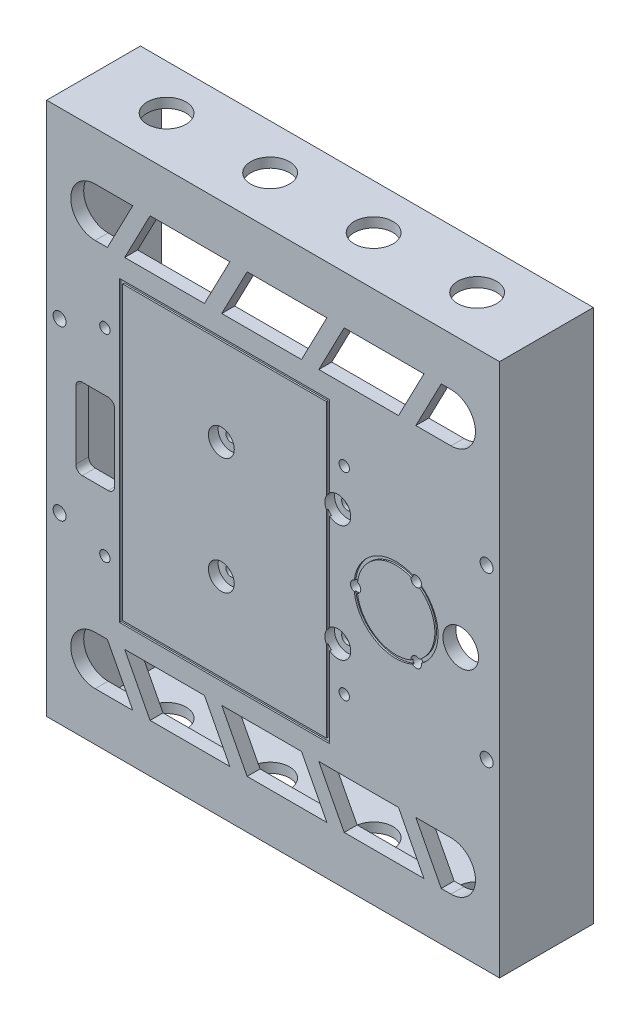
from build123d import *
from build123d.topology import SkipClean

# Parameters (mm, degrees)
SKETCH_1_W               = 140
SKETCH_1_H               = 165
SKETCH_1_R               = 2
SKETCH_1_R_2             = 5.5
SKETCH_1_R_3             = 1.6
SKETCH_1_R_4             = 1.818943246
EXTRUDE_1_DEPTH          = 4
SKETCH_3_W               = 65
SKETCH_3_H               = 92.1
SKETCH_3_W_2             = 63
SKETCH_3_H_2             = 90.1
CUT_EXTRUDE_2_DEPTH      = 0.5
SKETCH_4_R               = 13
SKETCH_4_R_2             = 12
CUT_EXTRUDE_3_DEPTH      = 0.5
EXTRUDE_START            = 25
SKETCH_5_W               = 140
SKETCH_5_H               = 165
SKETCH_5_R               = 1.962484256
SKETCH_5_R_2             = 2
SKETCH_5_W_2             = 127
SKETCH_5_H_2             = 159
EXTRUDE_2_DEPTH          = 25
CUT_EXTRUDE_7_DEPTH      = 1
CUT_EXTRUDE_8_DEPTH      = 181.969610852
CUT_EXTRUDE_8_DEPTH_BACK = 181.969610852
SKETCH_11_R              = 6
SKETCH_12_R              = 4
CUT_EXTRUDE_9_DEPTH      = 3


with BuildPart() as part:
    # 草图1 → 凸台-拉伸1 (new body)
    with BuildSketch(Plane.XY):
        Rectangle(SKETCH_1_W, SKETCH_1_H)
        with Locations((-66, 26)):
            Circle(SKETCH_1_R, mode=Mode.SUBTRACT)
        with Locations((-66, -26)):
            Circle(SKETCH_1_R, mode=Mode.SUBTRACT)
        with Locations((58, 0)):
            Circle(SKETCH_1_R_2, mode=Mode.SUBTRACT)
        with Locations((66, -26)):
            Circle(SKETCH_1_R, mode=Mode.SUBTRACT)
        with Locations((66, 26)):
            Circle(SKETCH_1_R, mode=Mode.SUBTRACT)
        with Locations((-16, 18)):
            Circle(SKETCH_1_R_3, mode=Mode.SUBTRACT)
        with Locations((-52, 30.55)):
            Circle(SKETCH_1_R_3, mode=Mode.SUBTRACT)
        with Locations((-52, -30.55)):
            Circle(SKETCH_1_R_3, mode=Mode.SUBTRACT)
        with Locations((25.5, 0)):
            Circle(SKETCH_1_R_3, mode=Mode.SUBTRACT)
        with Locations((44.25, 10.825317547)):
            Circle(SKETCH_1_R_3, mode=Mode.SUBTRACT)
        with Locations((44.25, -10.825317547)):
            Circle(SKETCH_1_R_3, mode=Mode.SUBTRACT)
        with Locations((20, 18)):
            Circle(SKETCH_1_R_4, mode=Mode.SUBTRACT)
        with Locations((20, -18)):
            Circle(SKETCH_1_R_4, mode=Mode.SUBTRACT)
        with Locations((-16, -18)):
            Circle(SKETCH_1_R_3, mode=Mode.SUBTRACT)
        with Locations((22, 30.55)):
            Circle(SKETCH_1_R_3, mode=Mode.SUBTRACT)
        with Locations((22, -30.55)):
            Circle(SKETCH_1_R_3, mode=Mode.SUBTRACT)
        with BuildLine():
            Line((-59, -12.5), (-51, -12.5))
            ThreePointArc((-51, -12.5), (-49.585786438, -11.914213562), (-49, -10.5))
            Line((-49, -10.5), (-49, 10.5))
            ThreePointArc((-49, 10.5), (-49.585786438, 11.914213562), (-51, 12.5))
            Line((-51, 12.5), (-59, 12.5))
            ThreePointArc((-59, 12.5), (-60.414213562, 11.914213562), (-61, 10.5))
            Line((-61, 10.5), (-61, -10.5))
            ThreePointArc((-61, -10.5), (-60.414213562, -11.914213562), (-59, -12.5))
        make_face(mode=Mode.SUBTRACT)
        with BuildLine():
            Line((-55, -52.452945218), (-51.222417483, -52.452945218))
            Line((-51.222417483, -52.452945218), (-43.373561338, -67.547054782))
            Line((-43.373561338, -67.547054782), (-55, -67.547054782))
            ThreePointArc((-55, -67.547054782), (-62.547054782, -60), (-55, -52.452945218))
        make_face(mode=Mode.SUBTRACT)
        Polygon((-45.874212334, -52.452945218), (-38.025356189, -67.547054782), (-13.373561338, -67.547054782), (-21.222417483, -52.452945218), align=None, mode=Mode.SUBTRACT)
        Polygon((-15.874212334, -52.452945218), (-8.025356189, -67.547054782), (16.626438662, -67.547054782), (8.777582517, -52.452945218), align=None, mode=Mode.SUBTRACT)
        Polygon((14.125787666, -52.452945218), (21.974643811, -67.547054782), (46.626438662, -67.547054782), (38.777582517, -52.452945218), align=None, mode=Mode.SUBTRACT)
        with BuildLine():
            Line((44.125787666, -52.452945218), (51.974643811, -67.547054782))
            Line((51.974643811, -67.547054782), (55, -67.547054782))
            ThreePointArc((55, -67.547054782), (62.547054782, -60), (55, -52.452945218))
            Line((55, -52.452945218), (44.125787666, -52.452945218))
        make_face(mode=Mode.SUBTRACT)
        with BuildLine():
            Line((51.974643811, 67.547054782), (55, 67.547054782))
            ThreePointArc((55, 67.547054782), (62.547054782, 60), (55, 52.452945218))
            Line((55, 52.452945218), (44.125787666, 52.452945218))
            Line((44.125787666, 52.452945218), (51.974643811, 67.547054782))
        make_face(mode=Mode.SUBTRACT)
        Polygon((14.125787666, 52.452945218), (38.777582517, 52.452945218), (46.626438662, 67.547054782), (21.974643811, 67.547054782), align=None, mode=Mode.SUBTRACT)
        Polygon((-15.874212334, 52.452945218), (8.777582517, 52.452945218), (16.626438662, 67.547054782), (-8.025356189, 67.547054782), align=None, mode=Mode.SUBTRACT)
        Polygon((-45.874212334, 52.452945218), (-21.222417483, 52.452945218), (-13.373561338, 67.547054782), (-38.025356189, 67.547054782), align=None, mode=Mode.SUBTRACT)
        with BuildLine():
            Line((-55, 67.547054782), (-43.373561338, 67.547054782))
            Line((-43.373561338, 67.547054782), (-51.222417483, 52.452945218))
            Line((-51.222417483, 52.452945218), (-55, 52.452945218))
            ThreePointArc((-55, 52.452945218), (-62.547054782, 60), (-55, 67.547054782))
        make_face(mode=Mode.SUBTRACT)
    extrude(amount=EXTRUDE_1_DEPTH)

    # 草图3 → 切除-拉伸2 (cut)
    with BuildSketch(Plane.XY.offset(4)):
        with Locations((-15, 0)):
            Rectangle(SKETCH_3_W, SKETCH_3_H)
        with Locations((-15, 0)):
            Rectangle(SKETCH_3_W_2, SKETCH_3_H_2, mode=Mode.SUBTRACT)
    extrude(amount=-CUT_EXTRUDE_2_DEPTH, mode=Mode.SUBTRACT)

    # 草图4 → 切除-拉伸3 (cut)
    with BuildSketch(Plane.XY.offset(4)):
        with Locations((38, 0)):
            Circle(SKETCH_4_R)
        with Locations((38, 0)):
            Circle(SKETCH_4_R_2, mode=Mode.SUBTRACT)
    extrude(amount=-CUT_EXTRUDE_3_DEPTH, mode=Mode.SUBTRACT)

    # 草图5 → 凸台-拉伸2 (add)
    with SkipClean():  # the faces are left unmerged after this step: merging them gives an invalid solid
        with BuildSketch(Plane(origin=(0, 0, 0), x_dir=(-1, 0, 0), z_dir=(0, 0, -1)).offset(EXTRUDE_START)):
            Rectangle(SKETCH_5_W, SKETCH_5_H)
            with Locations((66, 26)):
                Circle(SKETCH_5_R, mode=Mode.SUBTRACT)
            with Locations((66, -26)):
                Circle(SKETCH_5_R_2, mode=Mode.SUBTRACT)
            with Locations((-66, 26)):
                Circle(SKETCH_5_R_2, mode=Mode.SUBTRACT)
            with Locations((-66, -26)):
                Circle(SKETCH_5_R_2, mode=Mode.SUBTRACT)
            Rectangle(SKETCH_5_W_2, SKETCH_5_H_2, mode=Mode.SUBTRACT)
        extrude(amount=-EXTRUDE_2_DEPTH)

    # 草图10 → 切除-拉伸7 (cut)
    # profile 1 of 18: a face of its own
    with SkipClean():  # the faces are left unmerged after this step: merging them gives an invalid solid
        with BuildSketch(Plane.ZY.offset(70)):
            with BuildLine():
                add(Edge.make_bspline(
                    [(-7.472052502, 43.920203976), (-7.425042323, 43.90147481), (-7.33047454, 43.86379838), (-7.210411131, 43.763422453), (-7.10833199, 43.635427544), (-7.059333068, 43.534662266), (-7.033608267, 43.481759742)],
                    knots=[0, 0, 0, 0, 0.945216195, 1.901439255, 2.898239911, 4, 4, 4, 4], degree=3))
                add(Edge.make_bspline(
                    [(-7.033608267, 43.481759742), (-7.034305889, 43.460609694), (-7.035556725, 43.422687655), (-7.051773087, 43.372426001), (-7.087037533, 43.339699858), (-7.115995565, 43.337009436), (-7.13104032, 43.335611663)],
                    knots=[0, 0, 0, 0, 1.275399987, 2.286792394, 3.109926104, 4, 4, 4, 4], degree=3))
                add(Edge.make_bspline(
                    [(-7.13104032, 43.335611663), (-7.223910798, 43.304382297), (-7.415115767, 43.240086193), (-7.717799606, 43.163402178), (-8.043114957, 43.100400266), (-8.39198907, 43.05283487), (-8.763309396, 43.016393251), (-9.15762589, 42.996064692), (-9.574039385, 42.986038175), (-9.859138637, 42.991698098), (-10.00528586, 42.99459948)],
                    knots=[0, 0, 0, 0, 0.807794876, 1.663116154, 2.572620009, 3.539203655, 4.565748325, 5.648644608, 6.794651129, 8, 8, 8, 8], degree=3))
                add(Edge.make_bspline(
                    [(-10.00528586, 42.99459948), (-10.017478052, 42.961748265), (-10.044715335, 42.888358852), (-10.070958977, 42.760670471), (-10.096173178, 42.607226229), (-10.117664577, 42.426033515), (-10.13333926, 42.217156778), (-10.143235086, 41.980657308), (-10.151092855, 41.717208943), (-10.151316613, 41.532524375), (-10.151433938, 41.435686645)],
                    knots=[0, 0, 0, 0, 0.5342141, 1.193430986, 1.984297314, 2.908945431, 3.977097495, 5.181019119, 6.521892153, 8, 8, 8, 8], degree=3))
                add(Edge.make_bspline(
                    [(-10.151433938, 41.435686645), (-10.157333426, 41.196934), (-10.168863796, 40.730299237), (-10.167486411, 40.045014634), (-10.147021864, 39.390276775), (-10.117255282, 38.964329076), (-10.102717912, 38.75630521)],
                    knots=[0, 0, 0, 0, 1.068872754, 2.089079199, 3.066746612, 4, 4, 4, 4], degree=3))
                add(Edge.make_bspline(
                    [(-10.102717912, 38.75630521), (-10.09730502, 38.75630521), (-10.075052021, 38.75630521), (-10.024531697, 38.75630521), (-9.940331158, 38.75630521), (-9.823051836, 38.75630521), (-9.672693731, 38.75630521), (-9.48865541, 38.75630521), (-9.270936874, 38.75630521), (-9.114564444, 38.75630521), (-9.030965338, 38.75630521)],
                    knots=[0, 0, 0, 0, 0.121212121, 0.498316498, 1.131313131, 2.006734007, 3.124579125, 4.498316498, 6.127946128, 8, 8, 8, 8], degree=3))
                add(Edge.make_bspline(
                    [(-9.030965338, 38.75630521), (-9.008703198, 38.757373717), (-8.951465279, 38.760120943), (-8.8480451, 38.769930186), (-8.707812722, 38.784140793), (-8.602714023, 38.797521312), (-8.543805077, 38.805021236)],
                    knots=[0, 0, 0, 0, 0.546085336, 1.404033463, 2.54493295, 4, 4, 4, 4], degree=3))
                add(Edge.make_bspline(
                    [(-8.543805077, 38.805021236), (-8.489085306, 38.812308476), (-8.38452682, 38.826232927), (-8.234896723, 38.845040832), (-8.098831638, 38.857193708), (-7.976196726, 38.866948852), (-7.867206006, 38.870945033), (-7.772104266, 38.868826501), (-7.690696978, 38.864278148), (-7.641021895, 38.857055453), (-7.618200581, 38.853737262)],
                    knots=[0, 0, 0, 0, 1.424813453, 2.722532182, 3.89181002, 4.950217317, 5.897623448, 6.704963851, 7.405045231, 8, 8, 8, 8], degree=3))
                add(Edge.make_bspline(
                    [(-7.618200581, 38.853737262), (-7.59788828, 38.842996146), (-7.554205921, 38.819896978), (-7.506695014, 38.752521731), (-7.465124177, 38.666158385), (-7.432387441, 38.555015267), (-7.405872558, 38.420401895), (-7.386466611, 38.261812876), (-7.376496087, 38.078623332), (-7.375271786, 37.948593473), (-7.37462045, 37.87941674)],
                    knots=[0, 0, 0, 0, 0.522518742, 1.123696016, 1.848238073, 2.732912306, 3.77840836, 5.00640235, 6.407386525, 8, 8, 8, 8], degree=3))
                add(Edge.make_bspline(
                    [(-7.37462045, 37.87941674), (-7.388603754, 37.877161368), (-7.416570362, 37.872650625), (-7.421081105, 37.844684018), (-7.423336476, 37.830700714)],
                    knots=[0, 0, 0, 0, 1, 2, 2, 2, 2], degree=3))
                add(Edge.make_bspline(
                    [(-7.423336476, 37.830700714), (-7.518657632, 37.862381109), (-7.711461711, 37.926460371), (-8.010422658, 38.005114929), (-8.32106265, 38.072085456), (-8.644566312, 38.125372839), (-8.979685533, 38.169071174), (-9.327013949, 38.199324693), (-9.686320243, 38.217845619), (-9.930083849, 38.219558284), (-10.054001886, 38.220428923)],
                    knots=[0, 0, 0, 0, 0.902136976, 1.82473332, 2.775254714, 3.755825413, 4.769057781, 5.810433545, 6.886926633, 8, 8, 8, 8], degree=3))
                add(Edge.make_bspline(
                    [(-10.054001886, 38.220428923), (-10.046033109, 38.10785215), (-10.031346732, 37.900374259), (-9.996459526, 37.617073746), (-9.960740264, 37.387148322), (-9.92388348, 37.254906639), (-9.907853807, 37.197392374)],
                    knots=[0, 0, 0, 0, 1.307687446, 2.410055161, 3.308504663, 4, 4, 4, 4], degree=3))
                add(Edge.make_bspline(
                    [(-9.907853807, 37.197392374), (-9.91486784, 37.183811884), (-9.92694304, 37.160432019), (-9.951871275, 37.134145509), (-9.982981334, 37.131552019), (-9.997344371, 37.142579259), (-10.00528586, 37.148676348)],
                    knots=[0, 0, 0, 0, 1.397228319, 2.40543657, 3.118347461, 4, 4, 4, 4], degree=3))
                add(Edge.make_bspline(
                    [(-10.00528586, 37.148676348), (-10.073927228, 37.165830906), (-10.205354113, 37.198676553), (-10.382969749, 37.27869906), (-10.533911475, 37.377078622), (-10.654740973, 37.497182821), (-10.745881397, 37.638173941), (-10.805103525, 37.79949119), (-10.838760661, 37.979678039), (-10.835272248, 38.10601747), (-10.833458303, 38.171712896)],
                    knots=[0, 0, 0, 0, 1.161860691, 2.224602081, 3.187677129, 4.111063848, 5.005649008, 5.926169544, 6.92162586, 8, 8, 8, 8], degree=3))
                add(Edge.make_bspline(
                    [(-10.833458303, 38.171712896), (-10.898413005, 38.171712896), (-11.028322408, 38.171712896), (-11.158231811, 38.171712896), (-11.223186512, 38.171712896)],
                    knots=[0, 0, 0, 0, 1, 2, 2, 2, 2], degree=3))
                add(Edge.make_bspline(
                    [(-11.223186512, 38.171712896), (-11.369862818, 38.148369341), (-11.647327742, 38.104210759), (-12.04216874, 38.049000357), (-12.390274708, 38.001617558), (-12.69335249, 37.964882867), (-12.950230767, 37.939075803), (-13.16195308, 37.924412298), (-13.328344528, 37.91781267), (-13.423845316, 37.925071347), (-13.464123713, 37.928132766)],
                    knots=[0, 0, 0, 0, 1.578958796, 2.986887902, 4.238427223, 5.313866479, 6.232589355, 6.982441795, 7.570834814, 8, 8, 8, 8], degree=3))
                add(Edge.make_bspline(
                    [(-13.464123713, 37.928132766), (-13.50642092, 37.932971742), (-13.586021289, 37.942078355), (-13.696358855, 37.972819762), (-13.789492204, 38.016353602), (-13.867872407, 38.070231749), (-13.927385402, 38.13950533), (-13.969458648, 38.221040742), (-13.994959882, 38.314562617), (-13.998276463, 38.380846885), (-14, 38.415293027)],
                    knots=[0, 0, 0, 0, 1.257850275, 2.367185793, 3.369843172, 4.287987714, 5.158180134, 6.041366607, 6.982151164, 8, 8, 8, 8], degree=3))
                add(Edge.make_bspline(
                    [(-14, 38.415293027), (-13.998766377, 38.446289703), (-13.996374732, 38.506383462), (-13.96329484, 38.589777694), (-13.912843907, 38.663403606), (-13.841045052, 38.724690622), (-13.74940235, 38.773094095), (-13.639876844, 38.813478428), (-13.509456554, 38.8384278), (-13.416086059, 38.84844043), (-13.366691661, 38.853737262)],
                    knots=[0, 0, 0, 0, 0.863923098, 1.674901712, 2.474586774, 3.34685873, 4.290050262, 5.367434435, 6.607333165, 8, 8, 8, 8], degree=3))
                add(Edge.make_bspline(
                    [(-13.366691661, 38.853737262), (-13.301730319, 38.852786593), (-13.155525555, 38.850646976), (-12.911944989, 38.840690571), (-12.619571496, 38.826759734), (-12.408587481, 38.812631522), (-12.294939086, 38.805021236)],
                    knots=[0, 0, 0, 0, 0.726554596, 1.635214737, 2.726187632, 4, 4, 4, 4], degree=3))
                add(Edge.make_bspline(
                    [(-12.294939086, 38.805021236), (-12.154780261, 38.797608425), (-11.886416338, 38.783415021), (-11.502866555, 38.756723203), (-11.155625855, 38.734938524), (-10.936878, 38.716368654), (-10.833458303, 38.707589184)],
                    knots=[0, 0, 0, 0, 1.14980852, 2.201553302, 3.149729669, 4, 4, 4, 4], degree=3))
                add(Edge.make_bspline(
                    [(-10.833458303, 38.707589184), (-10.800522662, 38.82534761), (-10.732616517, 39.068139931), (-10.670554881, 39.312492288), (-10.638594199, 39.438329575)],
                    knots=[0, 0, 0, 0, 0.970034188, 2, 2, 2, 2], degree=3))
                add(Edge.make_bspline(
                    [(-10.638594199, 39.438329575), (-10.628060266, 39.613299974), (-10.607474006, 39.955241226), (-10.592604071, 40.457060206), (-10.594746211, 40.9360269), (-10.609762307, 41.392268857), (-10.642559785, 41.825579715), (-10.688766158, 42.23624837), (-10.750761323, 42.624218084), (-10.806386566, 42.873351186), (-10.833458303, 42.99459948)],
                    knots=[0, 0, 0, 0, 1.176801846, 2.299800993, 3.369850443, 4.392083728, 5.363899973, 6.286494624, 7.166069854, 8, 8, 8, 8], degree=3))
                add(Edge.make_bspline(
                    [(-10.833458303, 42.99459948), (-10.991759783, 43.00053064), (-11.299969216, 43.012078474), (-11.748621189, 43.060355889), (-12.171922935, 43.127501647), (-12.569984912, 43.219254819), (-12.942192675, 43.334347945), (-13.288705477, 43.471830658), (-13.610485686, 43.63045817), (-13.80632652, 43.75940433), (-13.902567948, 43.822771924)],
                    knots=[0, 0, 0, 0, 1.179218875, 2.295912728, 3.357551876, 4.368894037, 5.334910719, 6.255483432, 7.142697863, 8, 8, 8, 8], degree=3))
                add(Edge.make_bspline(
                    [(-13.902567948, 43.822771924), (-13.931778893, 43.865356346), (-13.99017665, 43.950490004), (-14.029529446, 44.106606095), (-14.037772976, 44.27772314), (-14.013062623, 44.394400932), (-14, 44.456080264)],
                    knots=[0, 0, 0, 0, 0.926771825, 1.852777933, 2.864914922, 4, 4, 4, 4], degree=3))
                add(Edge.make_bspline(
                    [(-14, 44.456080264), (-13.979643489, 44.48604027), (-13.941344481, 44.542407419), (-13.876654106, 44.614890733), (-13.8060785, 44.666361139), (-13.733786751, 44.702746099), (-13.656600898, 44.716627822), (-13.577037626, 44.7154392), (-13.494643554, 44.692513984), (-13.442605082, 44.665212973), (-13.415407687, 44.650944368)],
                    knots=[0, 0, 0, 0, 1.24438184, 2.341196352, 3.316629159, 4.231750243, 5.095002018, 5.98384619, 6.946277051, 8, 8, 8, 8], degree=3))
                add(Edge.make_bspline(
                    [(-13.415407687, 44.650944368), (-13.411202458, 44.649723781), (-13.395089026, 44.645046783), (-13.35832382, 44.636271687), (-13.297319974, 44.622328289), (-13.24876957, 44.609617864), (-13.220543582, 44.602228342)],
                    knots=[0, 0, 0, 0, 0.261564278, 1.002251685, 2.257184315, 4, 4, 4, 4], degree=3))
                add(Edge.make_bspline(
                    [(-13.220543582, 44.602228342), (-13.102333986, 44.54392945), (-12.873814041, 44.431227436), (-12.538589629, 44.27719343), (-12.221996356, 44.145868531), (-11.926511134, 44.031279776), (-11.649853217, 43.936466306), (-11.392657228, 43.862816169), (-11.155658777, 43.806316964), (-11.003252801, 43.784442097), (-10.930890356, 43.774055898)],
                    knots=[0, 0, 0, 0, 1.293669474, 2.500890666, 3.620233829, 4.657338963, 5.611272305, 6.489445851, 7.282788022, 8, 8, 8, 8], degree=3))
                add(Edge.make_bspline(
                    [(-10.930890356, 43.774055898), (-10.93199615, 43.808397226), (-10.93437601, 43.882305688), (-10.953549059, 43.99823803), (-10.985020402, 44.126471059), (-11.013300982, 44.21447321), (-11.028322408, 44.261216159)],
                    knots=[0, 0, 0, 0, 0.825772776, 1.777205482, 2.819347379, 4, 4, 4, 4], degree=3))
                add(Edge.make_bspline(
                    [(-11.028322408, 44.261216159), (-11.042087724, 44.288941159), (-11.065208017, 44.335508203), (-11.073630509, 44.386665056), (-11.077038434, 44.407364237)],
                    knots=[0, 0, 0, 0, 1.19075625, 2, 2, 2, 2], degree=3))
                add(Edge.make_bspline(
                    [(-11.077038434, 44.407364237), (-11.082778298, 44.421224885), (-11.092381927, 44.444415766), (-11.094855304, 44.482761448), (-11.064793037, 44.504525904), (-11.041812502, 44.504696277), (-11.028322408, 44.50479629)],
                    knots=[0, 0, 0, 0, 1.262516854, 2.11237452, 2.891921172, 4, 4, 4, 4], degree=3))
                add(Edge.make_bspline(
                    [(-11.028322408, 44.50479629), (-10.959169711, 44.510254001), (-10.827647801, 44.520634052), (-10.638752614, 44.497372105), (-10.471811973, 44.441727742), (-10.329129588, 44.350851808), (-10.210630649, 44.227472909), (-10.116274425, 44.072296205), (-10.046354342, 43.885319399), (-10.01947228, 43.748714234), (-10.00528586, 43.676623846)],
                    knots=[0, 0, 0, 0, 1.113051232, 2.116918526, 3.037358095, 3.919888581, 4.808858283, 5.764141448, 6.820074562, 8, 8, 8, 8], degree=3))
                add(Edge.make_bspline(
                    [(-10.00528586, 43.676623846), (-9.903073268, 43.68433903), (-9.704180475, 43.699351804), (-9.414763801, 43.712941957), (-9.143497972, 43.722723719), (-8.969025571, 43.724488236), (-8.884817259, 43.725339872)],
                    knots=[0, 0, 0, 0, 1.096462801, 2.13357812, 3.099179968, 4, 4, 4, 4], degree=3))
                add(Edge.make_bspline(
                    [(-8.884817259, 43.725339872), (-8.800619013, 43.733766448), (-8.642403736, 43.749600662), (-8.419576345, 43.77180056), (-8.227862751, 43.797374205), (-8.110154382, 43.814834549), (-8.056644816, 43.822771924)],
                    knots=[0, 0, 0, 0, 1.217534859, 2.287845912, 3.221664314, 4, 4, 4, 4], degree=3))
                add(Edge.make_bspline(
                    [(-8.056644816, 43.822771924), (-8.054389444, 43.836755228), (-8.049878701, 43.864721836), (-8.021912093, 43.869232579), (-8.00792879, 43.87148795)],
                    knots=[0, 0, 0, 0, 1, 2, 2, 2, 2], degree=3))
                add(Edge.make_bspline(
                    [(-8.00792879, 43.87148795), (-7.948178269, 43.892532921), (-7.840988997, 43.930286486), (-7.69111588, 43.957813059), (-7.566305132, 43.964903035), (-7.501000068, 43.933932282), (-7.472052502, 43.920203976)],
                    knots=[0, 0, 0, 0, 1.368380695, 2.454802546, 3.315065293, 4, 4, 4, 4], degree=3))
            make_face()
        # profile 2 of 18: a face of its own
        with BuildSketch(Plane.ZY.offset(70)):
            with BuildLine():
                add(Edge.make_bspline(
                    [(-8.495089051, 33.646535361), (-8.499613027, 33.635035511), (-8.511151569, 33.605704792), (-8.475782317, 33.551047887), (-8.427597606, 33.481119437), (-8.377919057, 33.431751899), (-8.348940972, 33.40295523)],
                    knots=[0, 0, 0, 0, 0.475340205, 1.212369729, 2.373942337, 4, 4, 4, 4], degree=3))
                add(Edge.make_bspline(
                    [(-8.348940972, 33.40295523), (-8.334207875, 33.380866089), (-8.307955501, 33.341506248), (-8.276804107, 33.287046804), (-8.256364351, 33.244337741), (-8.252893757, 33.218429167), (-8.25150892, 33.208091126)],
                    knots=[0, 0, 0, 0, 1.447791382, 2.579767102, 3.43329856, 4, 4, 4, 4], degree=3))
                add(Edge.make_bspline(
                    [(-8.25150892, 33.208091126), (-8.281255225, 33.158935615), (-8.33984144, 33.062122402), (-8.40130709, 32.905102392), (-8.438943412, 32.74195809), (-8.443878265, 32.630917893), (-8.446373024, 32.574782787)],
                    knots=[0, 0, 0, 0, 1.024683425, 2.018143895, 2.998095224, 4, 4, 4, 4], degree=3))
                add(Edge.make_bspline(
                    [(-8.446373024, 32.574782787), (-8.473520437, 32.480009738), (-8.526764965, 32.294130287), (-8.623805395, 32.027418543), (-8.735004502, 31.779195551), (-8.85522964, 31.546531166), (-8.990110415, 31.332434238), (-9.137672865, 31.136568857), (-9.294187775, 30.955794732), (-9.466992679, 30.795946838), (-9.6492627, 30.650093862), (-9.845212203, 30.523439233), (-10.053186532, 30.415151671), (-10.273691698, 30.324388666), (-10.506014501, 30.250646247), (-10.750442716, 30.194925046), (-11.006856922, 30.156598558), (-11.182167864, 30.144945974), (-11.271902538, 30.138981481)],
                    knots=[0, 0, 0, 0, 1.171858887, 2.298380094, 3.370721835, 4.403794618, 5.409608176, 6.374930282, 7.317337042, 8.248170712, 9.169480337, 10.08976269, 11.017267178, 11.953441146, 12.921328739, 13.911774513, 14.931120709, 16, 16, 16, 16], degree=3))
                add(Edge.make_bspline(
                    [(-11.271902538, 30.138981481), (-11.376136781, 30.14888857), (-11.579632837, 30.168230136), (-11.874453243, 30.221997213), (-12.149211064, 30.298439791), (-12.406160327, 30.391539473), (-12.643075737, 30.507341413), (-12.86095873, 30.643124886), (-13.05968109, 30.799007932), (-13.236422205, 30.97697025), (-13.395294383, 31.173818616), (-13.534246447, 31.391086717), (-13.653521198, 31.628842017), (-13.752786875, 31.886344623), (-13.83170094, 32.164356386), (-13.892501736, 32.461648725), (-13.934708497, 32.779407771), (-13.945649773, 32.998062836), (-13.951283974, 33.110659074)],
                    knots=[0, 0, 0, 0, 1.120903282, 2.188334571, 3.203972553, 4.171868233, 5.110876662, 6.022267727, 6.916475062, 7.809080601, 8.702266833, 9.620549765, 10.565283371, 11.546036075, 12.571368407, 13.656374934, 14.793152285, 16, 16, 16, 16], degree=3))
                add(Edge.make_bspline(
                    [(-13.951283974, 33.110659074), (-13.943839031, 33.219077418), (-13.929305565, 33.430723694), (-13.881785726, 33.736960741), (-13.816965, 34.024048484), (-13.734456588, 34.292454686), (-13.632170253, 34.541555475), (-13.51005205, 34.770784238), (-13.37143785, 34.981758663), (-13.211576865, 35.171810872), (-13.033892373, 35.342606785), (-12.836979361, 35.493440475), (-12.621758843, 35.625332333), (-12.387639719, 35.737283866), (-12.135129482, 35.829829197), (-11.863591943, 35.900537351), (-11.574346468, 35.956027228), (-11.374368509, 35.97512115), (-11.271902538, 35.984904614)],
                    knots=[0, 0, 0, 0, 1.18940914, 2.321876595, 3.388972301, 4.409541632, 5.392738008, 6.332457464, 7.249287672, 8.151433154, 9.045636869, 9.942576232, 10.861886119, 11.804370139, 12.779351017, 13.801618467, 14.873579376, 16, 16, 16, 16], degree=3))
                add(Edge.make_bspline(
                    [(-11.271902538, 35.984904614), (-11.17489347, 35.973486006), (-10.985429365, 35.951184832), (-10.71013293, 35.89806445), (-10.450131782, 35.832077887), (-10.205343034, 35.750554008), (-9.975836273, 35.655354478), (-9.761909587, 35.545297703), (-9.565038919, 35.420182656), (-9.381726235, 35.282546442), (-9.216828079, 35.127033404), (-9.065802783, 34.95807303), (-8.929964385, 34.77544639), (-8.810464131, 34.577836635), (-8.707826826, 34.365382199), (-8.619185654, 34.139390004), (-8.546348886, 33.898669977), (-8.512394739, 33.731657817), (-8.495089051, 33.646535361)],
                    knots=[0, 0, 0, 0, 1.189143351, 2.322463095, 3.411368851, 4.4535844, 5.461471972, 6.434344333, 7.379161537, 8.299067604, 9.221419459, 10.134360209, 11.055722884, 11.988972735, 12.942155319, 13.925474968, 14.942659835, 16, 16, 16, 16], degree=3))
            make_face()
            with BuildLine():
                add(Edge.make_bspline(
                    [(-11.271902538, 30.821005847), (-11.188770547, 30.826289351), (-11.027248439, 30.836554986), (-10.793948621, 30.873523704), (-10.575373799, 30.923776906), (-10.371726242, 30.989183466), (-10.184135357, 31.074092871), (-10.009999816, 31.170402644), (-9.8517833, 31.284797147), (-9.710599496, 31.416038918), (-9.58301188, 31.561333124), (-9.471093161, 31.722332624), (-9.374633323, 31.899682184), (-9.293803021, 32.092561524), (-9.229512461, 32.301304321), (-9.178514234, 32.524309923), (-9.144610577, 32.763369489), (-9.133906545, 32.928326753), (-9.12839739, 33.013227021)],
                    knots=[0, 0, 0, 0, 1.159419716, 2.252705768, 3.284704983, 4.280523638, 5.225269862, 6.147740327, 7.047344656, 7.936360884, 8.826638575, 9.735049263, 10.660783508, 11.632936329, 12.64215327, 13.698635753, 14.815532958, 16, 16, 16, 16], degree=3))
                add(Edge.make_bspline(
                    [(-9.12839739, 33.013227021), (-9.133866548, 33.105942275), (-9.144445822, 33.285286155), (-9.178644793, 33.545287659), (-9.229169845, 33.786990429), (-9.293125887, 34.012098641), (-9.37487231, 34.218366079), (-9.4699276, 34.407928228), (-9.583227587, 34.578220455), (-9.708706527, 34.732768415), (-9.851967603, 34.86749262), (-10.008861555, 34.986313306), (-10.183951391, 35.082128763), (-10.371213631, 35.166117905), (-10.575748645, 35.224879387), (-10.793863255, 35.270987551), (-11.027647564, 35.29803695), (-11.18883572, 35.301233128), (-11.271902538, 35.302880248)],
                    knots=[0, 0, 0, 0, 1.251487509, 2.420816619, 3.530465334, 4.577098691, 5.570558139, 6.516727709, 7.429495587, 8.322064167, 9.193588743, 10.073889921, 10.966716113, 11.877826835, 12.834356235, 13.82794795, 14.880653152, 16, 16, 16, 16], degree=3))
                add(Edge.make_bspline(
                    [(-11.271902538, 35.302880248), (-11.349035836, 35.297608404), (-11.499209846, 35.287344433), (-11.716780966, 35.249907606), (-11.921243517, 35.200588713), (-12.111888666, 35.133896886), (-12.287765952, 35.049851801), (-12.451504782, 34.952979269), (-12.600489124, 34.837854142), (-12.736118356, 34.707881122), (-12.857835159, 34.561770762), (-12.966651544, 34.401573511), (-13.058379078, 34.223202406), (-13.14043925, 34.031517351), (-13.20326635, 33.822037777), (-13.259322446, 33.599845512), (-13.295924366, 33.360525214), (-13.310483625, 33.195552127), (-13.317975635, 33.110659074)],
                    knots=[0, 0, 0, 0, 1.106696193, 2.154672608, 3.157528131, 4.116545334, 5.041331061, 5.945464674, 6.836244627, 7.731843235, 8.630750003, 9.555375233, 10.499419057, 11.499347502, 12.537399035, 13.628020061, 14.779409288, 16, 16, 16, 16], degree=3))
                add(Edge.make_bspline(
                    [(-13.317975635, 33.110659074), (-13.314289193, 33.025773973), (-13.307106022, 32.860372132), (-13.277930214, 32.620437732), (-13.235224645, 32.394580861), (-13.175804107, 32.183976067), (-13.102028457, 31.987219355), (-13.01177502, 31.806492865), (-12.905920642, 31.640223193), (-12.78537861, 31.488602895), (-12.648621098, 31.351738431), (-12.496172893, 31.230936508), (-12.329737849, 31.12379458), (-12.147371298, 31.033133006), (-11.94984868, 30.958560384), (-11.738334668, 30.893644567), (-11.510002808, 30.850284762), (-11.352611895, 30.830930583), (-11.271902538, 30.821005847)],
                    knots=[0, 0, 0, 0, 1.187440577, 2.313773028, 3.375719033, 4.39784094, 5.369142652, 6.30919031, 7.216518933, 8.11994337, 9.011750883, 9.91517532, 10.834116984, 11.774164641, 12.756323267, 13.78313763, 14.86320289, 16, 16, 16, 16], degree=3))
            make_face(mode=Mode.SUBTRACT)
        # profile 3 of 18: a face of its own
        with BuildSketch(Plane.ZY.offset(70)):
            with BuildLine():
                add(Edge.make_bspline(
                    [(-7.277188398, 28.946340991), (-7.252093445, 28.943670545), (-7.200016232, 28.938128819), (-7.124916447, 28.89700267), (-7.050942783, 28.835123314), (-7.007962422, 28.780692971), (-6.984892241, 28.751476886)],
                    knots=[0, 0, 0, 0, 0.826512791, 1.71518485, 2.773600361, 4, 4, 4, 4], degree=3))
                add(Edge.make_bspline(
                    [(-6.984892241, 28.751476886), (-7.003454132, 28.672734721), (-7.039818611, 28.518471453), (-7.125470819, 28.300450917), (-7.236047514, 28.10063001), (-7.328491938, 27.982333029), (-7.37462045, 27.923304442)],
                    knots=[0, 0, 0, 0, 1.04864103, 2.054385877, 3.02916498, 4, 4, 4, 4], degree=3))
                add(Edge.make_bspline(
                    [(-7.37462045, 27.923304442), (-7.391828592, 27.916341664), (-7.427066467, 27.902083673), (-7.48658831, 27.898455899), (-7.551306276, 27.90345011), (-7.594912757, 27.91639258), (-7.618200581, 27.923304442)],
                    knots=[0, 0, 0, 0, 0.887825959, 1.818040637, 2.834735449, 4, 4, 4, 4], degree=3))
                add(Edge.make_bspline(
                    [(-7.618200581, 27.923304442), (-7.685786789, 27.947408842), (-7.826383616, 27.997552239), (-8.052500376, 28.050269143), (-8.297190632, 28.098455799), (-8.561781058, 28.133365949), (-8.845909079, 28.158579614), (-9.149887785, 28.172482596), (-9.473665288, 28.176248617), (-9.696159227, 28.170061823), (-9.810421755, 28.166884573)],
                    knots=[0, 0, 0, 0, 0.775588441, 1.613424949, 2.507822994, 3.472959194, 4.498393755, 5.592575769, 6.763658999, 8, 8, 8, 8], degree=3))
                add(Edge.make_bspline(
                    [(-9.810421755, 28.166884573), (-9.724674614, 28.089061104), (-9.556843738, 27.936739045), (-9.335690346, 27.685727541), (-9.146303806, 27.423225377), (-8.990425001, 27.146954038), (-8.865020795, 26.85934727), (-8.772587837, 26.559235254), (-8.711900882, 26.246943898), (-8.697331698, 26.033862265), (-8.689953155, 25.925947372)],
                    knots=[0, 0, 0, 0, 1.076022582, 2.106073863, 3.103941796, 4.080570842, 5.049839429, 6.015617242, 6.995012156, 8, 8, 8, 8], degree=3))
                add(Edge.make_bspline(
                    [(-8.689953155, 25.925947372), (-8.693730438, 25.837476288), (-8.701072222, 25.66551789), (-8.728901615, 25.415478718), (-8.776535403, 25.182969514), (-8.836507161, 24.965924128), (-8.916994633, 24.767222219), (-9.010346206, 24.583256629), (-9.120757083, 24.416976684), (-9.246331154, 24.266462105), (-9.390092479, 24.134564447), (-9.549140632, 24.01864653), (-9.7244521, 23.920655283), (-9.915056479, 23.839372975), (-10.121846949, 23.774722928), (-10.344528036, 23.725958052), (-10.583684939, 23.695562764), (-10.748570282, 23.688596578), (-10.833458303, 23.685010172)],
                    knots=[0, 0, 0, 0, 1.206900241, 2.345813143, 3.42463115, 4.43924016, 5.410495766, 6.341798467, 7.246748552, 8.125320552, 9.007137696, 9.89918464, 10.80216449, 11.738684615, 12.718757473, 13.751129112, 14.84221244, 16, 16, 16, 16], degree=3))
                add(Edge.make_bspline(
                    [(-10.833458303, 23.685010172), (-10.950142058, 23.684170944), (-11.189554521, 23.68244901), (-11.558249961, 23.672721562), (-11.945072257, 23.659161592), (-12.208958259, 23.644021957), (-12.343655113, 23.636294146)],
                    knots=[0, 0, 0, 0, 0.926570423, 1.901143032, 2.928668334, 4, 4, 4, 4], degree=3))
                add(Edge.make_bspline(
                    [(-12.343655113, 23.636294146), (-12.414036698, 23.632295008), (-12.550046464, 23.624566826), (-12.746717911, 23.609958555), (-12.927860874, 23.594482456), (-13.093651264, 23.575130806), (-13.244483399, 23.559154249), (-13.380034996, 23.535937958), (-13.500787437, 23.515868207), (-13.575461167, 23.498324439), (-13.610271791, 23.490146067)],
                    knots=[0, 0, 0, 0, 1.325328887, 2.56114822, 3.707718572, 4.742884165, 5.699410813, 6.558250643, 7.327900261, 8, 8, 8, 8], degree=3))
                add(Edge.make_bspline(
                    [(-13.610271791, 23.490146067), (-13.64136975, 23.499271517), (-13.701969822, 23.517054127), (-13.783918772, 23.561587672), (-13.85593975, 23.616785459), (-13.918408594, 23.683689437), (-13.966717069, 23.765653921), (-14.007003475, 23.85739385), (-14.033378299, 23.96239299), (-14.043445162, 24.036130488), (-14.048716026, 24.07473838)],
                    knots=[0, 0, 0, 0, 0.988449437, 1.926174909, 2.830871454, 3.754795411, 4.703987573, 5.725240046, 6.80896842, 8, 8, 8, 8], degree=3))
                add(Edge.make_bspline(
                    [(-14.048716026, 24.07473838), (-14.039441898, 24.118392434), (-14.022461321, 24.198321353), (-13.959330231, 24.297716527), (-13.865519377, 24.358913606), (-13.79401405, 24.364236177), (-13.756419869, 24.367034537)],
                    knots=[0, 0, 0, 0, 1.167922895, 2.138422597, 3.021269037, 4, 4, 4, 4], degree=3))
                add(Edge.make_bspline(
                    [(-13.756419869, 24.367034537), (-13.743188356, 24.367034537), (-13.705899546, 24.367034537), (-13.633727656, 24.367034537), (-13.529078414, 24.367034537), (-13.392553255, 24.367034537), (-13.224152177, 24.367034537), (-13.023875181, 24.367034537), (-12.791722266, 24.367034537), (-12.62632835, 24.367034537), (-12.538519217, 24.367034537)],
                    knots=[0, 0, 0, 0, 0.260740741, 0.734814815, 1.422222222, 2.322962963, 3.425185185, 4.740740741, 6.26962963, 8, 8, 8, 8], degree=3))
                add(Edge.make_bspline(
                    [(-12.538519217, 24.367034537), (-12.419428541, 24.363650185), (-12.195067429, 24.35727423), (-11.879399238, 24.344939945), (-11.60447, 24.339005182), (-11.371146224, 24.331343121), (-11.178698674, 24.325379581), (-11.02709219, 24.323096343), (-10.91648519, 24.317735637), (-10.856315438, 24.318158047), (-10.833458303, 24.318318511)],
                    knots=[0, 0, 0, 0, 1.676239097, 3.157953915, 4.444618601, 5.545195278, 6.44252323, 7.153530133, 7.678445151, 8, 8, 8, 8], degree=3))
                add(Edge.make_bspline(
                    [(-10.833458303, 24.318318511), (-10.721331201, 24.340934603), (-10.506038775, 24.384359192), (-10.207967921, 24.499266271), (-9.950239946, 24.650013539), (-9.730225223, 24.834571593), (-9.552226979, 25.057323811), (-9.416667947, 25.316016909), (-9.319316118, 25.608672291), (-9.289836996, 25.817581269), (-9.274545468, 25.925947372)],
                    knots=[0, 0, 0, 0, 1.12603557, 2.162072544, 3.132089095, 4.057450599, 4.976867535, 5.923706533, 6.922976724, 8, 8, 8, 8], degree=3))
                add(Edge.make_bspline(
                    [(-9.274545468, 25.925947372), (-9.289937988, 26.041316273), (-9.320182343, 26.268001577), (-9.410705647, 26.596196668), (-9.535107548, 26.905709757), (-9.695284069, 27.197373391), (-9.89189828, 27.469223394), (-10.122999231, 27.722635973), (-10.387558903, 27.95991632), (-10.58585057, 28.096830078), (-10.687310225, 28.166884573)],
                    knots=[0, 0, 0, 0, 1.016872811, 1.998026497, 2.967851573, 3.928246874, 4.900379535, 5.894528829, 6.922696139, 8, 8, 8, 8], degree=3))
                add(Edge.make_bspline(
                    [(-10.687310225, 28.166884573), (-10.746854766, 28.167173121), (-10.871969481, 28.167779417), (-11.067408784, 28.162755028), (-11.279737679, 28.159965135), (-11.508888186, 28.154393449), (-11.754836225, 28.146500341), (-12.017743725, 28.140578394), (-12.296720925, 28.128365073), (-12.488595228, 28.121630633), (-12.587235243, 28.118168547)],
                    knots=[0, 0, 0, 0, 0.751843857, 1.579770872, 2.468443421, 3.43319904, 4.4740728, 5.575677168, 6.753688037, 8, 8, 8, 8], degree=3))
                add(Edge.make_bspline(
                    [(-12.587235243, 28.118168547), (-12.656391663, 28.11383169), (-12.786280135, 28.105686275), (-12.969281178, 28.09610766), (-13.127402557, 28.082984195), (-13.261579173, 28.070868892), (-13.370969976, 28.057739771), (-13.456597903, 28.047814829), (-13.518103255, 28.037113445), (-13.549612399, 28.025237867), (-13.561555765, 28.020736495)],
                    knots=[0, 0, 0, 0, 1.695292242, 3.184070506, 4.483031189, 5.576760395, 6.480231657, 7.177422767, 7.688206657, 8, 8, 8, 8], degree=3))
                add(Edge.make_bspline(
                    [(-13.561555765, 28.020736495), (-13.59609856, 28.026205971), (-13.663025694, 28.036803157), (-13.756681355, 28.071209237), (-13.83819892, 28.122610084), (-13.905171325, 28.190787186), (-13.960751761, 28.272675486), (-14.003939843, 28.369672852), (-14.034373322, 28.482317362), (-14.043785865, 28.563044852), (-14.048716026, 28.605328808)],
                    knots=[0, 0, 0, 0, 1.002210184, 1.941795862, 2.84218099, 3.745540421, 4.664924491, 5.669362636, 6.779244012, 8, 8, 8, 8], degree=3))
                add(Edge.make_bspline(
                    [(-14.048716026, 28.605328808), (-14.044223363, 28.635455894), (-14.036006374, 28.690557726), (-14.020302156, 28.765590078), (-14.001090646, 28.825998705), (-13.978285316, 28.871237248), (-13.953203489, 28.903907151), (-13.920740708, 28.918380845), (-13.885439807, 28.91589769), (-13.864906327, 28.904019635), (-13.853851922, 28.897624965)],
                    knots=[0, 0, 0, 0, 1.735956294, 3.175028974, 4.367567619, 5.333596316, 6.062464501, 6.661192676, 7.279239611, 8, 8, 8, 8], degree=3))
                add(Edge.make_bspline(
                    [(-13.853851922, 28.897624965), (-13.592271846, 28.882905739), (-13.065699363, 28.853275275), (-12.269872989, 28.824805988), (-11.46382254, 28.810213137), (-10.646969577, 28.811043064), (-9.819865203, 28.822825975), (-8.981428417, 28.851102589), (-8.132597305, 28.8893249), (-7.563411097, 28.927263215), (-7.277188398, 28.946340991)],
                    knots=[0, 0, 0, 0, 0.955352391, 1.923167422, 2.903661986, 3.894965305, 4.901737722, 5.919890432, 6.953989807, 8, 8, 8, 8], degree=3))
            make_face()
        # profile 4 of 18: a face of its own
        with BuildSketch(Plane.ZY.offset(70)):
            with BuildLine():
                Line((-13.561555765, 17.535965099), (-13.025679478, 17.535965099))
                add(Edge.make_bspline(
                    [(-13.025679478, 17.535965099), (-13.102904855, 17.620740575), (-13.253955773, 17.7865593), (-13.450902725, 18.050091429), (-13.61437276, 18.318809662), (-13.747305721, 18.590960488), (-13.85043927, 18.86786797), (-13.915811931, 19.151132546), (-13.954830894, 19.43839142), (-13.952470583, 19.631236422), (-13.951283974, 19.728186274)],
                    knots=[0, 0, 0, 0, 1.124136744, 2.198783547, 3.220442418, 4.204374525, 5.165339805, 6.110978285, 7.05032345, 8, 8, 8, 8], degree=3))
                add(Edge.make_bspline(
                    [(-13.951283974, 19.728186274), (-13.943733504, 19.830586105), (-13.92906203, 20.029561321), (-13.88326605, 20.317785151), (-13.820914707, 20.587044836), (-13.740063237, 20.837300469), (-13.640377193, 21.06715242), (-13.524929162, 21.279252221), (-13.388895052, 21.470278842), (-13.236759899, 21.644292082), (-13.064198737, 21.795722282), (-12.874629604, 21.928389213), (-12.668475447, 22.043152612), (-12.442434229, 22.13437792), (-12.19965253, 22.208189175), (-11.939148274, 22.264625338), (-11.660036382, 22.298068165), (-11.468054171, 22.306037651), (-11.369334591, 22.310135657)],
                    knots=[0, 0, 0, 0, 1.196352176, 2.324656514, 3.397595797, 4.41512771, 5.385315531, 6.314045333, 7.224310117, 8.113270902, 9.002231686, 9.89295968, 10.806027442, 11.745934014, 12.728278127, 13.760863388, 14.848608808, 16, 16, 16, 16], degree=3))
                add(Edge.make_bspline(
                    [(-11.369334591, 22.310135657), (-11.262750051, 22.302498802), (-11.055438673, 22.287644799), (-10.754819954, 22.242997068), (-10.474306015, 22.176967563), (-10.211354292, 22.097526884), (-9.968760999, 21.995809848), (-9.745357733, 21.876820491), (-9.541847565, 21.738537146), (-9.356704863, 21.583213244), (-9.191589691, 21.408794576), (-9.045817576, 21.216061689), (-8.921862715, 21.004159272), (-8.816489122, 20.77438467), (-8.730010868, 20.526754259), (-8.663709343, 20.260376343), (-8.616727059, 19.976088022), (-8.600730462, 19.780067058), (-8.592521103, 19.679470248)],
                    knots=[0, 0, 0, 0, 1.197546759, 2.329278429, 3.402046146, 4.425576517, 5.404669979, 6.345725992, 7.258215761, 8.157662124, 9.049420229, 9.944713487, 10.860435079, 11.795556064, 12.774208435, 13.796138983, 14.86899143, 16, 16, 16, 16], degree=3))
                add(Edge.make_bspline(
                    [(-8.592521103, 19.679470248), (-8.59854977, 19.579445697), (-8.610447451, 19.382045476), (-8.659097957, 19.092595551), (-8.726811312, 18.813383628), (-8.819259848, 18.545195697), (-8.935357541, 18.28829607), (-9.073624175, 18.041519993), (-9.23301199, 17.803913835), (-9.357847486, 17.658092239), (-9.420693546, 17.584681125)],
                    knots=[0, 0, 0, 0, 1.045370808, 2.063057786, 3.058898571, 4.041691322, 5.019558769, 5.997668034, 6.991963989, 8, 8, 8, 8], degree=3))
                add(Edge.make_bspline(
                    [(-9.420693546, 17.584681125), (-9.323261494, 17.600919801), (-9.12839739, 17.633397151), (-8.933533285, 17.665874502), (-8.836101233, 17.682113178)],
                    knots=[0, 0, 0, 0, 1, 2, 2, 2, 2], degree=3))
                add(Edge.make_bspline(
                    [(-8.836101233, 17.682113178), (-8.777875897, 17.680405471), (-8.672812971, 17.677324053), (-8.535276856, 17.631525901), (-8.432796157, 17.551612217), (-8.409342166, 17.47613637), (-8.397656998, 17.438533047)],
                    knots=[0, 0, 0, 0, 1.274076052, 2.298967503, 3.152517309, 4, 4, 4, 4], degree=3))
                add(Edge.make_bspline(
                    [(-8.397656998, 17.438533047), (-8.414310257, 17.399661845), (-8.446573859, 17.324353764), (-8.506934753, 17.22013107), (-8.575260868, 17.128005021), (-8.651463923, 17.047826899), (-8.735040479, 16.980130167), (-8.826623231, 16.926108139), (-8.924764263, 16.881047778), (-8.995115954, 16.863091026), (-9.030965338, 16.853940734)],
                    knots=[0, 0, 0, 0, 1.127847543, 2.185063252, 3.205951248, 4.182333094, 5.129922562, 6.065884726, 7.014425385, 8, 8, 8, 8], degree=3))
                add(Edge.make_bspline(
                    [(-9.030965338, 16.853940734), (-9.19013378, 16.876360423), (-9.517726331, 16.92250351), (-10.027039846, 16.955035172), (-10.56644522, 16.96941802), (-10.935711459, 16.957504225), (-11.12575446, 16.951372786)],
                    knots=[0, 0, 0, 0, 0.918085852, 1.88955852, 2.913860538, 4, 4, 4, 4], degree=3))
                add(Edge.make_bspline(
                    [(-11.12575446, 16.951372786), (-11.225019514, 16.942666685), (-11.418898701, 16.925662396), (-11.702961453, 16.895408944), (-11.972946811, 16.858951811), (-12.230004326, 16.819765354), (-12.473201313, 16.77506487), (-12.702248015, 16.724182905), (-12.917796193, 16.670496425), (-13.055874026, 16.630054127), (-13.12311153, 16.610360603)],
                    knots=[0, 0, 0, 0, 1.177993822, 2.300794455, 3.376738236, 4.398408691, 5.374583319, 6.299243515, 7.171810432, 8, 8, 8, 8], degree=3))
                add(Edge.make_bspline(
                    [(-13.12311153, 16.610360603), (-13.169665453, 16.611493593), (-13.258508165, 16.613655771), (-13.383195645, 16.646410077), (-13.494896016, 16.693688207), (-13.587807535, 16.767647351), (-13.669589579, 16.8560886), (-13.730742578, 16.96868935), (-13.777467806, 17.09907084), (-13.79563395, 17.194010173), (-13.805135896, 17.243668943)],
                    knots=[0, 0, 0, 0, 1.078106312, 2.057439688, 2.976726367, 3.873765041, 4.793900749, 5.75745927, 6.827021312, 8, 8, 8, 8], degree=3))
                add(Edge.make_bspline(
                    [(-13.805135896, 17.243668943), (-13.803545083, 17.28692163), (-13.800679712, 17.364828323), (-13.752747026, 17.466466668), (-13.666092168, 17.528790875), (-13.598074884, 17.53345883), (-13.561555765, 17.535965099)],
                    knots=[0, 0, 0, 0, 1.190078677, 2.143568411, 3.00326442, 4, 4, 4, 4], degree=3))
            make_face()
            with BuildLine():
                Line((-12.343655113, 17.535965099), (-10.395014068, 17.633397151))
                add(Edge.make_bspline(
                    [(-10.395014068, 17.633397151), (-10.297834032, 17.684351416), (-10.108814549, 17.78345972), (-9.856365123, 17.972446296), (-9.640411401, 18.188978875), (-9.462948026, 18.435076571), (-9.319972534, 18.706807263), (-9.217785677, 19.00698591), (-9.15005977, 19.333819574), (-9.135768516, 19.561854614), (-9.12839739, 19.679470248)],
                    knots=[0, 0, 0, 0, 1.033745105, 2.01068009, 2.961434958, 3.907846752, 4.861980891, 5.846987144, 6.889521663, 8, 8, 8, 8], degree=3))
                add(Edge.make_bspline(
                    [(-9.12839739, 19.679470248), (-9.140080249, 19.752415411), (-9.163022715, 19.895663048), (-9.212793257, 20.103047885), (-9.27900661, 20.297364492), (-9.35518115, 20.480088618), (-9.448568317, 20.649461799), (-9.555104278, 20.806274811), (-9.673895159, 20.952105137), (-9.809415564, 21.081900314), (-9.955737689, 21.202066337), (-10.116809271, 21.309128748), (-10.293286921, 21.400063008), (-10.481473598, 21.482302845), (-10.683910552, 21.550155158), (-10.899727685, 21.606119087), (-11.12938905, 21.64974691), (-11.287994074, 21.667647175), (-11.369334591, 21.676827318)],
                    knots=[0, 0, 0, 0, 1.078034116, 2.117012722, 3.10801113, 4.071610617, 5.00267411, 5.925424369, 6.835816371, 7.742136529, 8.659316774, 9.596649015, 10.558647837, 11.553371525, 12.591571104, 13.671033838, 14.805590727, 16, 16, 16, 16], degree=3))
                add(Edge.make_bspline(
                    [(-11.369334591, 21.676827318), (-11.444628754, 21.671265725), (-11.590952908, 21.660457511), (-11.803056514, 21.627180973), (-12.003384937, 21.583274813), (-12.190177645, 21.521535357), (-12.364405256, 21.447949426), (-12.525026666, 21.360159125), (-12.673683061, 21.259968838), (-12.807339347, 21.14240898), (-12.931452498, 21.014921542), (-13.039943375, 20.870639728), (-13.135300781, 20.713180168), (-13.218977554, 20.54323115), (-13.287115193, 20.358395595), (-13.345030125, 20.160912705), (-13.388111509, 19.948938911), (-13.406168115, 19.80290955), (-13.415407687, 19.728186274)],
                    knots=[0, 0, 0, 0, 1.15456478, 2.243742484, 3.281658174, 4.288396346, 5.248872655, 6.171174324, 7.084807033, 7.984997742, 8.889550935, 9.802302944, 10.739627543, 11.702524688, 12.695418784, 13.749481113, 14.848408684, 16, 16, 16, 16], degree=3))
                add(Edge.make_bspline(
                    [(-13.415407687, 19.728186274), (-13.408630373, 19.627477241), (-13.395178496, 19.427586004), (-13.335333095, 19.133110334), (-13.246745116, 18.846490121), (-13.126793414, 18.567177954), (-12.975567631, 18.296116061), (-12.796672653, 18.031003918), (-12.584221103, 17.776200164), (-12.424939058, 17.617137229), (-12.343655113, 17.535965099)],
                    knots=[0, 0, 0, 0, 0.96657353, 1.918493022, 2.872104135, 3.837955404, 4.826203489, 5.843089885, 6.899297387, 8, 8, 8, 8], degree=3))
            make_face(mode=Mode.SUBTRACT)
        # profile 5 of 18: a face of its own
        with BuildSketch(Plane.ZY.offset(70)):
            with BuildLine():
                add(Edge.make_bspline(
                    [(-8.00792879, 14.60217775), (-8.006769375, 14.648104945), (-8.004572479, 14.735129258), (-7.973091025, 14.85574933), (-7.923935266, 14.959662603), (-7.852298269, 15.044124597), (-7.759866571, 15.108660854), (-7.649129972, 15.15646046), (-7.517704296, 15.182089888), (-7.424040849, 15.185153555), (-7.37462045, 15.186770063)],
                    knots=[0, 0, 0, 0, 1.113509881, 2.109913972, 3.005670076, 3.887356783, 4.767709163, 5.723717084, 6.79894649, 8, 8, 8, 8], degree=3))
                add(Edge.make_bspline(
                    [(-7.37462045, 15.186770063), (-7.324575705, 15.185253147), (-7.230266793, 15.182394532), (-7.096862769, 15.155509993), (-6.982512391, 15.10868571), (-6.884431403, 15.044533054), (-6.808011396, 14.959201588), (-6.748623609, 14.856894048), (-6.709081765, 14.735761914), (-6.698272592, 14.648174727), (-6.692596085, 14.60217775)],
                    knots=[0, 0, 0, 0, 1.187937226, 2.238657943, 3.212350082, 4.107858801, 4.997765892, 5.906847126, 6.900767253, 8, 8, 8, 8], degree=3))
                add(Edge.make_bspline(
                    [(-6.692596085, 14.60217775), (-6.702169757, 14.559696634), (-6.720770977, 14.477157709), (-6.768845783, 14.362438491), (-6.829248155, 14.259531693), (-6.909568466, 14.173075294), (-7.004546415, 14.100707215), (-7.113839111, 14.040797901), (-7.238472971, 13.994875469), (-7.32797516, 13.977779308), (-7.37462045, 13.96886941)],
                    knots=[0, 0, 0, 0, 1.041772765, 2.024118298, 2.968399343, 3.886578514, 4.832178695, 5.819165921, 6.863428467, 8, 8, 8, 8], degree=3))
                add(Edge.make_bspline(
                    [(-7.37462045, 13.96886941), (-7.42420277, 13.973935168), (-7.518732158, 13.983593107), (-7.649346996, 14.021448269), (-7.760704045, 14.075697614), (-7.8520909, 14.148051931), (-7.924233747, 14.237678635), (-7.97231425, 14.346020506), (-8.00455931, 14.468603879), (-8.006769918, 14.556237433), (-8.00792879, 14.60217775)],
                    knots=[0, 0, 0, 0, 1.183332698, 2.256040408, 3.215499352, 4.11122278, 5.006946208, 5.921988172, 6.910639631, 8, 8, 8, 8], degree=3))
            make_face()
        # profile 6 of 18: a face of its own
        with BuildSketch(Plane.ZY.offset(70)):
            with BuildLine():
                add(Edge.make_bspline(
                    [(-8.787385207, 15.089338011), (-8.757269558, 15.079395721), (-8.699642309, 15.060370836), (-8.624978651, 15.008164437), (-8.572772251, 14.933500778), (-8.553747366, 14.875873529), (-8.543805077, 14.84575788)],
                    knots=[0, 0, 0, 0, 1.0451878, 2, 2.9548122, 4, 4, 4, 4], degree=3))
                add(Edge.make_bspline(
                    [(-8.543805077, 14.84575788), (-8.562938042, 14.760549372), (-8.599982945, 14.595570196), (-8.706183966, 14.369365545), (-8.846630899, 14.170928128), (-8.969525199, 14.068695779), (-9.030965338, 14.017585436)],
                    knots=[0, 0, 0, 0, 1.062477358, 2.057149483, 3.028685578, 4, 4, 4, 4], degree=3))
                add(Edge.make_bspline(
                    [(-9.030965338, 14.017585436), (-9.05141404, 14.017585436), (-9.100130066, 14.017585436), (-9.148846092, 14.017585436), (-9.177113416, 14.017585436)],
                    knots=[0, 0, 0, 0, 0.839506173, 2, 2, 2, 2], degree=3))
                add(Edge.make_bspline(
                    [(-9.177113416, 14.017585436), (-9.189142064, 14.017585436), (-9.20538074, 14.017585436), (-9.221619415, 14.017585436), (-9.225829442, 14.017585436)],
                    knots=[0, 0, 0, 0, 1.481481481, 2, 2, 2, 2], degree=3))
                add(Edge.make_bspline(
                    [(-9.225829442, 14.017585436), (-9.240808241, 14.022021452), (-9.276946674, 14.032723955), (-9.340995313, 14.044377012), (-9.423688418, 14.054327187), (-9.523996527, 14.067550203), (-9.643155784, 14.079612705), (-9.780194436, 14.092897956), (-9.935563151, 14.102412078), (-10.044991413, 14.11066424), (-10.102717912, 14.115017489)],
                    knots=[0, 0, 0, 0, 0.424185523, 1.023406537, 1.765169065, 2.687274564, 3.771697888, 5.01871915, 6.427290155, 8, 8, 8, 8], degree=3))
                add(Edge.make_bspline(
                    [(-10.102717912, 14.115017489), (-10.229595023, 14.12273684), (-10.47723666, 14.137803647), (-10.839402541, 14.151429188), (-11.183440162, 14.161178831), (-11.406617097, 14.16289592), (-11.515482669, 14.163733515)],
                    knots=[0, 0, 0, 0, 1.078852375, 2.105728663, 3.075975601, 4, 4, 4, 4], degree=3))
                add(Edge.make_bspline(
                    [(-11.515482669, 14.163733515), (-11.567215002, 14.163495945), (-11.676140284, 14.162995727), (-11.847533791, 14.154584469), (-12.035274648, 14.144399163), (-12.239780525, 14.127731901), (-12.461026377, 14.105687963), (-12.699190076, 14.080351463), (-12.954326655, 14.051872956), (-13.129759397, 14.029278023), (-13.220543582, 14.017585436)],
                    knots=[0, 0, 0, 0, 0.724991607, 1.526509836, 2.404642359, 3.360199656, 4.401958858, 5.520902264, 6.717098839, 8, 8, 8, 8], degree=3))
                add(Edge.make_bspline(
                    [(-13.220543582, 14.017585436), (-13.271103048, 14.014759331), (-13.367115874, 14.009392534), (-13.5036882, 14.026815367), (-13.625973135, 14.057813152), (-13.732474227, 14.111372826), (-13.824579216, 14.183012304), (-13.901405793, 14.273042385), (-13.962187854, 14.38160209), (-13.98707435, 14.462650462), (-14, 14.504745697)],
                    knots=[0, 0, 0, 0, 1.19729748, 2.273677435, 3.248493425, 4.17251629, 5.076096592, 5.995714078, 6.959005777, 8, 8, 8, 8], degree=3))
                add(Edge.make_bspline(
                    [(-14, 14.504745697), (-13.994707243, 14.53555054), (-13.984583775, 14.594471023), (-13.958413476, 14.677834325), (-13.916905796, 14.748401536), (-13.869151819, 14.812341751), (-13.805211604, 14.860095728), (-13.734644393, 14.901603409), (-13.651281091, 14.927773708), (-13.592360608, 14.937897175), (-13.561555765, 14.943189932)],
                    knots=[0, 0, 0, 0, 1.108131953, 2.11952612, 3.074268881, 4, 4.925731119, 5.88047388, 6.891868047, 8, 8, 8, 8], degree=3))
                add(Edge.make_bspline(
                    [(-13.561555765, 14.943189932), (-13.554933846, 14.943314009), (-13.535612879, 14.943676031), (-13.498496862, 14.938239773), (-13.444225777, 14.936125584), (-13.373297377, 14.930050623), (-13.285564822, 14.922479348), (-13.18072017, 14.916546177), (-13.060050438, 14.904223772), (-12.973974868, 14.897856503), (-12.928247426, 14.894473906)],
                    knots=[0, 0, 0, 0, 0.249941643, 0.729262072, 1.412434216, 2.301208848, 3.418288805, 4.739293267, 6.26775731, 8, 8, 8, 8], degree=3))
                add(Edge.make_bspline(
                    [(-12.928247426, 14.894473906), (-12.846461326, 14.890095512), (-12.688917234, 14.881661437), (-12.462639655, 14.872245455), (-12.256417985, 14.85883093), (-12.069940716, 14.84662548), (-11.903441266, 14.833279869), (-11.7558997, 14.823570363), (-11.629016881, 14.810892491), (-11.550953216, 14.801369093), (-11.515482669, 14.797041854)],
                    knots=[0, 0, 0, 0, 1.387789888, 2.673291676, 3.837236361, 4.889314891, 5.839744596, 6.667464773, 7.394522997, 8, 8, 8, 8], degree=3))
                add(Edge.make_bspline(
                    [(-11.515482669, 14.797041854), (-11.36990925, 14.801194368), (-11.08766955, 14.809245318), (-10.678092304, 14.831736175), (-10.295372879, 14.857676144), (-9.940480014, 14.892137258), (-9.613167347, 14.931615254), (-9.313280966, 14.975938338), (-9.040519852, 15.027551337), (-8.869027565, 15.069410238), (-8.787385207, 15.089338011)],
                    knots=[0, 0, 0, 0, 1.271393112, 2.464994054, 3.580951291, 4.620163165, 5.577556684, 6.459022582, 7.266386657, 8, 8, 8, 8], degree=3))
            make_face()
        # profile 7 of 18: a face of its own
        with BuildSketch(Plane.ZY.offset(70)):
            with BuildLine():
                add(Edge.make_bspline(
                    [(-9.615557651, 9.302956688), (-9.483837961, 9.303630435), (-9.232979539, 9.304913578), (-8.875554685, 9.314947659), (-8.556624784, 9.334550708), (-8.275575511, 9.361268755), (-8.032523561, 9.393926033), (-7.827306115, 9.435894575), (-7.65765692, 9.479909358), (-7.562972668, 9.525994868), (-7.520768528, 9.546536819)],
                    knots=[0, 0, 0, 0, 1.489185334, 2.836133941, 4.041993834, 5.100863233, 6.027862717, 6.811977588, 7.47045615, 8, 8, 8, 8], degree=3))
                add(Edge.make_bspline(
                    [(-7.520768528, 9.546536819), (-7.505950685, 9.553064908), (-7.478827292, 9.56501428), (-7.43796454, 9.574472468), (-7.401160606, 9.567311003), (-7.383245693, 9.553288187), (-7.37462045, 9.546536819)],
                    knots=[0, 0, 0, 0, 1.241812144, 2.273080998, 3.168564469, 4, 4, 4, 4], degree=3))
                add(Edge.make_bspline(
                    [(-7.37462045, 9.546536819), (-7.328096187, 9.510059304), (-7.232206021, 9.434876275), (-7.122005938, 9.276489382), (-7.037051435, 9.083826398), (-7.002952601, 8.940450912), (-6.984892241, 8.864512453)],
                    knots=[0, 0, 0, 0, 0.877006895, 1.80758023, 2.838790497, 4, 4, 4, 4], degree=3))
                add(Edge.make_bspline(
                    [(-6.984892241, 8.864512453), (-7.001813544, 8.821877826), (-7.034968231, 8.738341837), (-7.103030635, 8.624028104), (-7.181581856, 8.521724261), (-7.275780402, 8.436608255), (-7.37968355, 8.363222854), (-7.496119327, 8.303483122), (-7.625396149, 8.257721139), (-7.717132498, 8.240214618), (-7.764348659, 8.231204114)],
                    knots=[0, 0, 0, 0, 1.03874392, 2.035258788, 3.006627522, 3.952575027, 4.902349712, 5.884479489, 6.911154007, 8, 8, 8, 8], degree=3))
                add(Edge.make_bspline(
                    [(-7.764348659, 8.231204114), (-7.774607408, 8.232197995), (-7.798972532, 8.234558519), (-7.841484836, 8.245099623), (-7.896697119, 8.258462867), (-7.937068288, 8.272319482), (-7.959212763, 8.27992014)],
                    knots=[0, 0, 0, 0, 0.613700686, 1.457574832, 2.605423756, 4, 4, 4, 4], degree=3))
                add(Edge.make_bspline(
                    [(-7.959212763, 8.27992014), (-7.991209902, 8.293895853), (-8.053463369, 8.321086927), (-8.121170135, 8.326167106), (-8.154076868, 8.328636166)],
                    knots=[0, 0, 0, 0, 1.027963259, 2, 2, 2, 2], degree=3))
                add(Edge.make_bspline(
                    [(-8.154076868, 8.328636166), (-8.251059836, 8.36088727), (-8.458853852, 8.429987922), (-8.801696633, 8.505881894), (-9.191846608, 8.572973453), (-9.469200101, 8.604366451), (-9.615557651, 8.620932323)],
                    knots=[0, 0, 0, 0, 0.820589956, 1.758181721, 2.817007757, 4, 4, 4, 4], degree=3))
                add(Edge.make_bspline(
                    [(-9.615557651, 8.620932323), (-9.774913135, 8.627671976), (-10.103743344, 8.641579257), (-10.612137651, 8.648749165), (-11.151145244, 8.640528578), (-11.520313527, 8.627591711), (-11.710346773, 8.620932323)],
                    knots=[0, 0, 0, 0, 0.913339599, 1.884677222, 2.911115411, 4, 4, 4, 4], degree=3))
                add(Edge.make_bspline(
                    [(-11.710346773, 8.620932323), (-11.780715323, 8.623311363), (-11.917366477, 8.627931306), (-12.115495953, 8.615335775), (-12.299789379, 8.586589914), (-12.469622232, 8.542445635), (-12.62510647, 8.48009595), (-12.766633198, 8.403204365), (-12.892704503, 8.307961635), (-13.004234074, 8.196116698), (-13.101578561, 8.068197333), (-13.183329806, 7.922646614), (-13.251865118, 7.762559758), (-13.303943422, 7.584997763), (-13.34125893, 7.392235543), (-13.363647103, 7.182845088), (-13.375726146, 6.957443361), (-13.369771239, 6.801601094), (-13.366691661, 6.721007305)],
                    knots=[0, 0, 0, 0, 1.140145766, 2.214089036, 3.210445239, 4.158164258, 5.050152223, 5.917972517, 6.759805585, 7.600340789, 8.469472816, 9.355319931, 10.298218476, 11.284663775, 12.347097877, 13.47472684, 14.694055606, 16, 16, 16, 16], degree=3))
                add(Edge.make_bspline(
                    [(-13.366691661, 6.721007305), (-13.363789677, 6.571762611), (-13.358173815, 6.282947278), (-13.318797629, 5.864271319), (-13.251986706, 5.475702003), (-13.153348056, 5.118135091), (-13.03253896, 4.789866972), (-12.881191807, 4.492682121), (-12.703772707, 4.224098593), (-12.560536719, 4.069335664), (-12.489803191, 3.992909843)],
                    knots=[0, 0, 0, 0, 1.218428394, 2.357878148, 3.429991016, 4.433036579, 5.382484571, 6.280683384, 7.150958281, 8, 8, 8, 8], degree=3))
                add(Edge.make_bspline(
                    [(-12.489803191, 3.992909843), (-12.452618722, 3.956929561), (-12.373615265, 3.880484562), (-12.218324856, 3.794667879), (-12.032771375, 3.718340464), (-11.810499128, 3.65915622), (-11.554846898, 3.611059222), (-11.264226794, 3.577665461), (-10.938969798, 3.558581496), (-10.710192418, 3.555884147), (-10.589878173, 3.554465608)],
                    knots=[0, 0, 0, 0, 0.620423789, 1.318174679, 2.116724731, 3.033567203, 4.079955669, 5.246371084, 6.551863904, 8, 8, 8, 8], degree=3))
                add(Edge.make_bspline(
                    [(-10.589878173, 3.554465608), (-10.535151308, 3.558721623), (-10.41429174, 3.568120665), (-10.215809107, 3.582445267), (-9.982446779, 3.59858177), (-9.713684498, 3.617297971), (-9.409785425, 3.633724788), (-9.071356968, 3.657068516), (-8.697765596, 3.677668312), (-8.436746259, 3.692733907), (-8.300224946, 3.700613686)],
                    knots=[0, 0, 0, 0, 0.574194851, 1.268059879, 2.081603609, 3.021108319, 4.08618889, 5.265072042, 6.569546766, 8, 8, 8, 8], degree=3))
                add(Edge.make_bspline(
                    [(-8.300224946, 3.700613686), (-8.25032145, 3.704476812), (-8.155976695, 3.711780221), (-8.022977851, 3.71821727), (-7.906335316, 3.724584108), (-7.806483181, 3.726245637), (-7.723261774, 3.725507934), (-7.657302496, 3.718982292), (-7.606931128, 3.714621315), (-7.580212043, 3.704626515), (-7.569484555, 3.700613686)],
                    knots=[0, 0, 0, 0, 1.636521449, 3.093915785, 4.353909543, 5.455370411, 6.360211351, 7.070634441, 7.626867513, 8, 8, 8, 8], degree=3))
                add(Edge.make_bspline(
                    [(-7.569484555, 3.700613686), (-7.538802763, 3.699294685), (-7.480770499, 3.696799895), (-7.398182895, 3.685819469), (-7.327321907, 3.660800574), (-7.264024495, 3.632093329), (-7.214525092, 3.588043974), (-7.173426441, 3.537685896), (-7.146460401, 3.475683589), (-7.136316623, 3.431368235), (-7.13104032, 3.40831753)],
                    knots=[0, 0, 0, 0, 1.267805179, 2.397956621, 3.418133837, 4.361469365, 5.241651579, 6.125325208, 7.024884824, 8, 8, 8, 8], degree=3))
                add(Edge.make_bspline(
                    [(-7.13104032, 3.40831753), (-7.13104032, 3.400498908), (-7.13104032, 3.368021558), (-7.13104032, 3.335544207), (-7.13104032, 3.310885478)],
                    knots=[0, 0, 0, 0, 0.481481481, 2, 2, 2, 2], degree=3))
                add(Edge.make_bspline(
                    [(-7.13104032, 3.310885478), (-7.13104032, 3.244126479), (-7.13104032, 3.12263713), (-7.13104032, 2.958446079), (-7.13104032, 2.830340973), (-7.13104032, 2.756966218), (-7.13104032, 2.726293164)],
                    knots=[0, 0, 0, 0, 1.37037037, 2.49382716, 3.37037037, 4, 4, 4, 4], degree=3))
                add(Edge.make_bspline(
                    [(-7.13104032, 2.726293164), (-7.177692795, 2.682846367), (-7.264636437, 2.601876968), (-7.373081284, 2.553737644), (-7.423336476, 2.53142906)],
                    knots=[0, 0, 0, 0, 1.07316587, 2, 2, 2, 2], degree=3))
                add(Edge.make_bspline(
                    [(-7.423336476, 2.53142906), (-7.709396652, 2.568897576), (-8.267973754, 2.642060697), (-9.090762265, 2.716065882), (-9.876532927, 2.767045058), (-10.388924132, 2.772399944), (-10.638594199, 2.775009191)],
                    knots=[0, 0, 0, 0, 1.072768762, 2.094748299, 3.071638401, 4, 4, 4, 4], degree=3))
                add(Edge.make_bspline(
                    [(-10.638594199, 2.775009191), (-10.79379536, 2.77301383), (-11.089411596, 2.769213207), (-11.511306219, 2.794813383), (-11.889095069, 2.841737793), (-12.223748951, 2.91235988), (-12.515582171, 3.008416267), (-12.763098887, 3.130986954), (-12.970789472, 3.275764173), (-13.073632931, 3.398152031), (-13.12311153, 3.457033556)],
                    knots=[0, 0, 0, 0, 1.398193288, 2.663180061, 3.805237359, 4.825688877, 5.740837878, 6.56486484, 7.309547949, 8, 8, 8, 8], degree=3))
                add(Edge.make_bspline(
                    [(-13.12311153, 3.457033556), (-13.193888839, 3.55788468), (-13.337525378, 3.762553473), (-13.51494003, 4.10107306), (-13.664904538, 4.467444279), (-13.786541766, 4.862732811), (-13.884748896, 5.286356257), (-13.951845169, 5.739480236), (-13.991346857, 6.221111198), (-13.99706285, 6.551326814), (-14, 6.721007305)],
                    knots=[0, 0, 0, 0, 0.85949358, 1.744269245, 2.661299528, 3.620203649, 4.628617641, 5.694602339, 6.815377022, 8, 8, 8, 8], degree=3))
                add(Edge.make_bspline(
                    [(-14, 6.721007305), (-13.99881179, 6.834716577), (-13.996508064, 7.055178415), (-13.973279012, 7.373944289), (-13.933369572, 7.669665569), (-13.88049195, 7.94255575), (-13.810658141, 8.192735589), (-13.723858377, 8.419041697), (-13.623579866, 8.623330872), (-13.504899736, 8.8029475), (-13.373964326, 8.962220013), (-13.223260007, 9.095201841), (-13.058060085, 9.206447067), (-12.876472171, 9.293903387), (-12.678340665, 9.354009899), (-12.467022397, 9.396597437), (-12.239100415, 9.412319054), (-12.083212212, 9.404453813), (-12.00264293, 9.40038874)],
                    knots=[0, 0, 0, 0, 1.412354936, 2.738302333, 3.967134361, 5.117320531, 6.188714414, 7.189089437, 8.124619687, 9.009433152, 9.857921714, 10.678145547, 11.496632229, 12.32535251, 13.171271586, 14.062120512, 14.998426072, 16, 16, 16, 16], degree=3))
                add(Edge.make_bspline(
                    [(-12.00264293, 9.40038874), (-11.941341983, 9.407461835), (-11.809967368, 9.422620248), (-11.598102948, 9.436836156), (-11.358511664, 9.441783714), (-11.092029, 9.436631318), (-10.798390243, 9.428739735), (-10.477251071, 9.409366689), (-10.128352985, 9.384590843), (-9.886771487, 9.362901302), (-9.761705729, 9.351672714)],
                    knots=[0, 0, 0, 0, 0.659459471, 1.413293571, 2.268437374, 3.219870841, 4.261705564, 5.407696898, 6.65797524, 8, 8, 8, 8], degree=3))
                add(Edge.make_bspline(
                    [(-9.761705729, 9.351672714), (-9.732445575, 9.350271284), (-9.678895872, 9.347706494), (-9.635322188, 9.316920756), (-9.615557651, 9.302956688)],
                    knots=[0, 0, 0, 0, 1.092822288, 2, 2, 2, 2], degree=3))
            make_face()
        # profile 8 of 18: a face of its own
        with BuildSketch(Plane.ZY.offset(70)):
            with BuildLine():
                add(Edge.make_bspline(
                    [(-9.030965338, 0.19125551), (-9.140474689, 0.207178377), (-9.351846068, 0.237912177), (-9.562673691, 0.272175646), (-9.664273677, 0.288687562)],
                    knots=[0, 0, 0, 0, 1.036179567, 2, 2, 2, 2], degree=3))
                add(Edge.make_bspline(
                    [(-9.664273677, 0.288687562), (-9.578549616, 0.202886469), (-9.410323003, 0.034508686), (-9.187346179, -0.238805439), (-8.993463994, -0.521226846), (-8.83184059, -0.816540789), (-8.699041841, -1.121084237), (-8.600553719, -1.43780604), (-8.527690005, -1.763636549), (-8.506016714, -1.986187591), (-8.495089051, -2.098397717)],
                    knots=[0, 0, 0, 0, 1.068965819, 2.097759932, 3.105407595, 4.08570498, 5.062049102, 6.029871724, 7.006662287, 8, 8, 8, 8], degree=3))
                add(Edge.make_bspline(
                    [(-8.495089051, -2.098397717), (-8.500229297, -2.189352844), (-8.510209495, -2.36594945), (-8.549156655, -2.621575528), (-8.602870027, -2.860526007), (-8.672198169, -3.083485393), (-8.761531334, -3.28856667), (-8.86621626, -3.477482899), (-8.987856368, -3.649810791), (-9.125141683, -3.806714337), (-9.282045229, -3.943999652), (-9.454373121, -4.06563976), (-9.64328935, -4.170324687), (-9.848370628, -4.259657852), (-10.071330013, -4.328985993), (-10.310280492, -4.382699366), (-10.56590657, -4.421646526), (-10.742503176, -4.431626723), (-10.833458303, -4.43676697)],
                    knots=[0, 0, 0, 0, 1.174074636, 2.27955918, 3.329293976, 4.329931007, 5.28506047, 6.208498098, 7.109989126, 8, 8.890010874, 9.791501902, 10.71493953, 11.670068993, 12.670706024, 13.72044082, 14.825925364, 16, 16, 16, 16], degree=3))
                add(Edge.make_bspline(
                    [(-10.833458303, -4.43676697), (-11.283968142, -4.43895298), (-12.177312633, -4.443287759), (-13.070221184, -4.471498708), (-13.512839739, -4.485482996)],
                    knots=[0, 0, 0, 0, 1.008591519, 2, 2, 2, 2], degree=3))
                add(Edge.make_bspline(
                    [(-13.512839739, -4.485482996), (-13.543808657, -4.480034791), (-13.60377218, -4.469485711), (-13.687324769, -4.434550495), (-13.759400315, -4.382149013), (-13.820802333, -4.315258808), (-13.870152335, -4.232636353), (-13.910373658, -4.136349432), (-13.93592794, -4.023354361), (-13.945992637, -3.943088854), (-13.951283974, -3.900890683)],
                    knots=[0, 0, 0, 0, 0.942625548, 1.825157352, 2.692579707, 3.600454246, 4.533158059, 5.569948564, 6.722443406, 8, 8, 8, 8], degree=3))
                add(Edge.make_bspline(
                    [(-13.951283974, -3.900890683), (-13.956487817, -3.865364024), (-13.965682882, -3.802589273), (-13.933224637, -3.713185344), (-13.854196684, -3.660762923), (-13.791519893, -3.658549888), (-13.756419869, -3.657310552)],
                    knots=[0, 0, 0, 0, 1.140651437, 2.015503686, 2.888649738, 4, 4, 4, 4], degree=3))
                add(Edge.make_bspline(
                    [(-13.756419869, -3.657310552), (-13.741384059, -3.657310552), (-13.704696681, -3.657310552), (-13.640944845, -3.657310552), (-13.558548603, -3.657310552), (-13.458109389, -3.657310552), (-13.339025769, -3.657310552), (-13.201899177, -3.657310552), (-13.046729613, -3.657310552), (-12.937268912, -3.657310552), (-12.8795314, -3.657310552)],
                    knots=[0, 0, 0, 0, 0.411522634, 1.004115226, 1.744855967, 2.666666667, 3.75308642, 5.004115226, 6.419753086, 8, 8, 8, 8], degree=3))
                add(Edge.make_bspline(
                    [(-12.8795314, -3.657310552), (-12.73338295, -3.66511533), (-12.424861375, -3.681591334), (-11.937806031, -3.707894187), (-11.401804067, -3.729934306), (-11.028318216, -3.746236967), (-10.833458303, -3.754742604)],
                    knots=[0, 0, 0, 0, 0.857388004, 1.809958972, 2.85738321, 4, 4, 4, 4], degree=3))
                add(Edge.make_bspline(
                    [(-10.833458303, -3.754742604), (-10.768456775, -3.751253752), (-10.641102069, -3.744418194), (-10.455514996, -3.722260722), (-10.281534396, -3.683314474), (-10.119077197, -3.635170337), (-9.966726217, -3.575657123), (-9.826724703, -3.500989442), (-9.695494166, -3.416951675), (-9.577411167, -3.317560452), (-9.469151672, -3.208204977), (-9.372039348, -3.085551574), (-9.288074402, -2.949957746), (-9.213885978, -2.803230213), (-9.150168295, -2.644591473), (-9.098230409, -2.473781391), (-9.058918936, -2.290077673), (-9.0404557, -2.163473853), (-9.030965338, -2.098397717)],
                    knots=[0, 0, 0, 0, 1.148071382, 2.249366996, 3.29181868, 4.288578627, 5.236084337, 6.170856024, 7.082961731, 7.979387508, 8.887040875, 9.793267357, 10.732183062, 11.695238139, 12.690020441, 13.743692286, 14.840226237, 16, 16, 16, 16], degree=3))
                add(Edge.make_bspline(
                    [(-9.030965338, -2.098397717), (-9.04636732, -1.968651506), (-9.076362205, -1.715974776), (-9.164303113, -1.353204314), (-9.282641838, -1.016589474), (-9.436413976, -0.707553921), (-9.625823165, -0.426695196), (-9.849937656, -0.174908551), (-10.105389945, 0.052099144), (-10.297629729, 0.176800593), (-10.395014068, 0.239971536)],
                    knots=[0, 0, 0, 0, 1.112371257, 2.166308603, 3.172801738, 4.146732324, 5.098947159, 6.050030753, 7.012189549, 8, 8, 8, 8], degree=3))
                add(Edge.make_bspline(
                    [(-10.395014068, 0.239971536), (-10.476198444, 0.24327078), (-10.646342238, 0.250185237), (-10.914028868, 0.255005234), (-11.206351249, 0.257187408), (-11.523354538, 0.253347178), (-11.864350415, 0.243595539), (-12.229480306, 0.231557986), (-12.619167971, 0.212807273), (-12.887356593, 0.198588887), (-13.025679478, 0.19125551)],
                    knots=[0, 0, 0, 0, 0.740807093, 1.552561429, 2.440937775, 3.40613131, 4.442913249, 5.551285578, 6.737033501, 8, 8, 8, 8], degree=3))
                add(Edge.make_bspline(
                    [(-13.025679478, 0.19125551), (-13.063008863, 0.190565578), (-13.132373874, 0.189283556), (-13.226891605, 0.180241942), (-13.304807518, 0.16831096), (-13.347656401, 0.150466664), (-13.366691661, 0.142539484)],
                    knots=[0, 0, 0, 0, 1.291002429, 2.398925103, 3.288735802, 4, 4, 4, 4], degree=3))
                add(Edge.make_bspline(
                    [(-13.366691661, 0.142539484), (-13.409043148, 0.144288543), (-13.490484492, 0.147651959), (-13.605182571, 0.182638989), (-13.703627844, 0.241759766), (-13.785169426, 0.32501448), (-13.852658352, 0.429612511), (-13.902052599, 0.558017063), (-13.936025168, 0.708185039), (-13.945986045, 0.81595817), (-13.951283974, 0.873279875)],
                    knots=[0, 0, 0, 0, 0.965073117, 1.855822732, 2.706259547, 3.561011924, 4.494480294, 5.530098502, 6.686324074, 8, 8, 8, 8], degree=3))
                add(Edge.make_bspline(
                    [(-13.951283974, 0.873279875), (-13.957093985, 0.894276626), (-13.967609746, 0.932279448), (-13.942126752, 0.989931724), (-13.879908458, 1.017181523), (-13.832968655, 1.01859176), (-13.805135896, 1.019427954)],
                    knots=[0, 0, 0, 0, 0.995737938, 1.8022242, 2.696838078, 4, 4, 4, 4], degree=3))
                add(Edge.make_bspline(
                    [(-13.805135896, 1.019427954), (-13.731816712, 1.011518314), (-13.569850887, 0.994045514), (-13.301236122, 0.981940625), (-12.984850973, 0.972709854), (-12.757451547, 0.971407682), (-12.635951269, 0.970711928)],
                    knots=[0, 0, 0, 0, 0.755687735, 1.669352845, 2.75472739, 4, 4, 4, 4], degree=3))
                add(Edge.make_bspline(
                    [(-12.635951269, 0.970711928), (-12.579418644, 0.967089702), (-12.459763317, 0.959423005), (-12.269801649, 0.947545085), (-12.057968853, 0.941885446), (-11.825257939, 0.933913411), (-11.570831859, 0.928628153), (-11.295357583, 0.925800447), (-10.99826454, 0.92093871), (-10.793164532, 0.921636015), (-10.687310225, 0.921995901)],
                    knots=[0, 0, 0, 0, 0.69735829, 1.476008488, 2.342740269, 3.305668768, 4.342416096, 5.475269553, 6.696959634, 8, 8, 8, 8], degree=3))
                add(Edge.make_bspline(
                    [(-10.687310225, 0.921995901), (-10.64459483, 0.922871641), (-10.554874993, 0.924711054), (-10.414693819, 0.934369155), (-10.262344567, 0.948363993), (-10.09829199, 0.971033609), (-9.921233503, 0.997455936), (-9.732554644, 1.032402447), (-9.531656754, 1.072085896), (-9.394188818, 1.101621138), (-9.323261494, 1.116860006)],
                    knots=[0, 0, 0, 0, 0.742796553, 1.560177213, 2.442605236, 3.402501385, 4.439298935, 5.555197925, 6.73859117, 8, 8, 8, 8], degree=3))
                add(Edge.make_bspline(
                    [(-9.323261494, 1.116860006), (-9.278755495, 1.116860006), (-9.197562118, 1.116860006), (-9.116368741, 1.116860006), (-9.079681364, 1.116860006)],
                    knots=[0, 0, 0, 0, 1.096296296, 2, 2, 2, 2], degree=3))
                add(Edge.make_bspline(
                    [(-9.079681364, 1.116860006), (-9.049022659, 1.119751644), (-8.989999453, 1.125318537), (-8.905110547, 1.115962163), (-8.828232456, 1.094390135), (-8.760997826, 1.058136867), (-8.703034809, 1.00762738), (-8.655832188, 0.942702902), (-8.61796372, 0.864315736), (-8.60125963, 0.806233035), (-8.592521103, 0.775847823)],
                    knots=[0, 0, 0, 0, 1.110025468, 2.136987232, 3.065192703, 3.979046259, 4.87226133, 5.81959669, 6.859350285, 8, 8, 8, 8], degree=3))
                add(Edge.make_bspline(
                    [(-8.592521103, 0.775847823), (-8.597812439, 0.733649651), (-8.607877136, 0.653384144), (-8.633431419, 0.540389073), (-8.673652741, 0.444102153), (-8.723002744, 0.361479698), (-8.784404762, 0.294589493), (-8.856480307, 0.24218801), (-8.940032896, 0.207252795), (-8.999996419, 0.196703715), (-9.030965338, 0.19125551)],
                    knots=[0, 0, 0, 0, 1.277556594, 2.430051436, 3.466841941, 4.399545754, 5.307420293, 6.174842648, 7.057374452, 8, 8, 8, 8], degree=3))
            make_face()
        # profile 9 of 18: a face of its own
        with BuildSketch(Plane.ZY.offset(70)):
            with BuildLine():
                add(Edge.make_bspline(
                    [(-8.00792879, -6.41427677), (-8.006769375, -6.368349574), (-8.004572479, -6.281325262), (-7.973091025, -6.160705189), (-7.923935266, -6.056791917), (-7.852298269, -5.972329923), (-7.759866571, -5.907793665), (-7.649129972, -5.85999406), (-7.517704296, -5.834364632), (-7.424040849, -5.831300964), (-7.37462045, -5.829684457)],
                    knots=[0, 0, 0, 0, 1.113509881, 2.109913972, 3.005670076, 3.887356783, 4.767709163, 5.723717084, 6.79894649, 8, 8, 8, 8], degree=3))
                add(Edge.make_bspline(
                    [(-7.37462045, -5.829684457), (-7.324575705, -5.831201372), (-7.230266793, -5.834059987), (-7.096862769, -5.860944527), (-6.982512391, -5.90776881), (-6.884431403, -5.971921466), (-6.808011396, -6.057252931), (-6.748623609, -6.159560472), (-6.709081765, -6.280692606), (-6.698272592, -6.368279793), (-6.692596085, -6.41427677)],
                    knots=[0, 0, 0, 0, 1.187937226, 2.238657943, 3.212350082, 4.107858801, 4.997765892, 5.906847126, 6.900767253, 8, 8, 8, 8], degree=3))
                add(Edge.make_bspline(
                    [(-6.692596085, -6.41427677), (-6.702169757, -6.456757886), (-6.720770977, -6.539296811), (-6.768845783, -6.654016029), (-6.829248155, -6.756922826), (-6.909568466, -6.843379226), (-7.004546415, -6.915747304), (-7.113839111, -6.975656619), (-7.238472971, -7.021579051), (-7.32797516, -7.038675211), (-7.37462045, -7.047585109)],
                    knots=[0, 0, 0, 0, 1.041772765, 2.024118298, 2.968399343, 3.886578514, 4.832178695, 5.819165921, 6.863428467, 8, 8, 8, 8], degree=3))
                add(Edge.make_bspline(
                    [(-7.37462045, -7.047585109), (-7.42420277, -7.042519351), (-7.518732158, -7.032861412), (-7.649346996, -6.995006251), (-7.760704045, -6.940756905), (-7.8520909, -6.868402588), (-7.924233747, -6.778775884), (-7.97231425, -6.670434014), (-8.00455931, -6.547850641), (-8.006769918, -6.460217087), (-8.00792879, -6.41427677)],
                    knots=[0, 0, 0, 0, 1.183332698, 2.256040408, 3.215499352, 4.11122278, 5.006946208, 5.921988172, 6.910639631, 8, 8, 8, 8], degree=3))
            make_face()
        # profile 10 of 18: a face of its own
        with BuildSketch(Plane.ZY.offset(70)):
            with BuildLine():
                add(Edge.make_bspline(
                    [(-8.787385207, -5.927116509), (-8.757269558, -5.937058798), (-8.699642309, -5.956083684), (-8.624978651, -6.008290083), (-8.572772251, -6.082953742), (-8.553747366, -6.140580991), (-8.543805077, -6.17069664)],
                    knots=[0, 0, 0, 0, 1.0451878, 2, 2.9548122, 4, 4, 4, 4], degree=3))
                add(Edge.make_bspline(
                    [(-8.543805077, -6.17069664), (-8.562938042, -6.255905148), (-8.599982945, -6.420884324), (-8.706183966, -6.647088975), (-8.846630899, -6.845526392), (-8.969525199, -6.947758741), (-9.030965338, -6.998869083)],
                    knots=[0, 0, 0, 0, 1.062477358, 2.057149483, 3.028685578, 4, 4, 4, 4], degree=3))
                add(Edge.make_bspline(
                    [(-9.030965338, -6.998869083), (-9.05141404, -6.998869083), (-9.100130066, -6.998869083), (-9.148846092, -6.998869083), (-9.177113416, -6.998869083)],
                    knots=[0, 0, 0, 0, 0.839506173, 2, 2, 2, 2], degree=3))
                add(Edge.make_bspline(
                    [(-9.177113416, -6.998869083), (-9.189142064, -6.998869083), (-9.20538074, -6.998869083), (-9.221619415, -6.998869083), (-9.225829442, -6.998869083)],
                    knots=[0, 0, 0, 0, 1.481481481, 2, 2, 2, 2], degree=3))
                add(Edge.make_bspline(
                    [(-9.225829442, -6.998869083), (-9.240808241, -6.994433068), (-9.276946674, -6.983730565), (-9.340995313, -6.972077508), (-9.423688418, -6.962127333), (-9.523996527, -6.948904316), (-9.643155784, -6.936841814), (-9.780194436, -6.923556564), (-9.935563151, -6.914042442), (-10.044991413, -6.90579028), (-10.102717912, -6.901437031)],
                    knots=[0, 0, 0, 0, 0.424185523, 1.023406537, 1.765169065, 2.687274564, 3.771697888, 5.01871915, 6.427290155, 8, 8, 8, 8], degree=3))
                add(Edge.make_bspline(
                    [(-10.102717912, -6.901437031), (-10.229595023, -6.893717679), (-10.47723666, -6.878650873), (-10.839402541, -6.865025332), (-11.183440162, -6.855275689), (-11.406617097, -6.8535586), (-11.515482669, -6.852721005)],
                    knots=[0, 0, 0, 0, 1.078852375, 2.105728663, 3.075975601, 4, 4, 4, 4], degree=3))
                add(Edge.make_bspline(
                    [(-11.515482669, -6.852721005), (-11.567215002, -6.852958575), (-11.676140284, -6.853458792), (-11.847533791, -6.861870051), (-12.035274648, -6.872055357), (-12.239780525, -6.888722618), (-12.461026377, -6.910766557), (-12.699190076, -6.936103056), (-12.954326655, -6.964581564), (-13.129759397, -6.987176496), (-13.220543582, -6.998869083)],
                    knots=[0, 0, 0, 0, 0.724991607, 1.526509836, 2.404642359, 3.360199656, 4.401958858, 5.520902264, 6.717098839, 8, 8, 8, 8], degree=3))
                add(Edge.make_bspline(
                    [(-13.220543582, -6.998869083), (-13.271103048, -7.001695189), (-13.367115874, -7.007061985), (-13.5036882, -6.989639152), (-13.625973135, -6.958641367), (-13.732474227, -6.905081693), (-13.824579216, -6.833442215), (-13.901405793, -6.743412134), (-13.962187854, -6.63485243), (-13.98707435, -6.553804057), (-14, -6.511708822)],
                    knots=[0, 0, 0, 0, 1.19729748, 2.273677435, 3.248493425, 4.17251629, 5.076096592, 5.995714078, 6.959005777, 8, 8, 8, 8], degree=3))
                add(Edge.make_bspline(
                    [(-14, -6.511708822), (-13.994707243, -6.480903979), (-13.984583775, -6.421983497), (-13.958413476, -6.338620194), (-13.916905796, -6.268052984), (-13.869151819, -6.204112768), (-13.805211604, -6.156358792), (-13.734644393, -6.114851111), (-13.651281091, -6.088680812), (-13.592360608, -6.078557345), (-13.561555765, -6.073264587)],
                    knots=[0, 0, 0, 0, 1.108131953, 2.11952612, 3.074268881, 4, 4.925731119, 5.88047388, 6.891868047, 8, 8, 8, 8], degree=3))
                add(Edge.make_bspline(
                    [(-13.561555765, -6.073264587), (-13.554933846, -6.073140511), (-13.535612879, -6.072778488), (-13.498496862, -6.078214747), (-13.444225777, -6.080328936), (-13.373297377, -6.086403897), (-13.285564822, -6.093975171), (-13.18072017, -6.099908342), (-13.060050438, -6.112230748), (-12.973974868, -6.118598017), (-12.928247426, -6.121980613)],
                    knots=[0, 0, 0, 0, 0.249941643, 0.729262072, 1.412434216, 2.301208848, 3.418288805, 4.739293267, 6.26775731, 8, 8, 8, 8], degree=3))
                add(Edge.make_bspline(
                    [(-12.928247426, -6.121980613), (-12.846461326, -6.126359007), (-12.688917234, -6.134793082), (-12.462639655, -6.144209065), (-12.256417985, -6.15762359), (-12.069940716, -6.169829039), (-11.903441266, -6.18317465), (-11.7558997, -6.192884157), (-11.629016881, -6.205562029), (-11.550953216, -6.215085427), (-11.515482669, -6.219412666)],
                    knots=[0, 0, 0, 0, 1.387789888, 2.673291676, 3.837236361, 4.889314891, 5.839744596, 6.667464773, 7.394522997, 8, 8, 8, 8], degree=3))
                add(Edge.make_bspline(
                    [(-11.515482669, -6.219412666), (-11.36990925, -6.215260152), (-11.08766955, -6.207209202), (-10.678092304, -6.184718344), (-10.295372879, -6.158778376), (-9.940480014, -6.124317262), (-9.613167347, -6.084839266), (-9.313280966, -6.040516181), (-9.040519852, -5.988903183), (-8.869027565, -5.947044282), (-8.787385207, -5.927116509)],
                    knots=[0, 0, 0, 0, 1.271393112, 2.464994054, 3.580951291, 4.620163165, 5.577556684, 6.459022582, 7.266386657, 8, 8, 8, 8], degree=3))
            make_face()
        # profile 11 of 18: a face of its own
        with BuildSketch(Plane.ZY.offset(70)):
            with BuildLine():
                add(Edge.make_bspline(
                    [(-8.689953155, -13.515990797), (-8.771146532, -13.467274771), (-8.933533285, -13.369842719), (-9.095920039, -13.272410667), (-9.177113416, -13.223694641)],
                    knots=[0, 0, 0, 0, 1, 2, 2, 2, 2], degree=3))
                add(Edge.make_bspline(
                    [(-9.177113416, -13.223694641), (-9.272449052, -13.147158976), (-9.455832033, -12.999938703), (-9.662485545, -12.887804992), (-9.761705729, -12.833966432)],
                    knots=[0, 0, 0, 0, 1.039743551, 2, 2, 2, 2], degree=3))
                add(Edge.make_bspline(
                    [(-9.761705729, -12.833966432), (-9.800804968, -12.812928884), (-9.883738634, -12.768305996), (-10.015335559, -12.697159013), (-10.163594827, -12.622517649), (-10.325775121, -12.538527194), (-10.504182526, -12.450853282), (-10.698040969, -12.356836305), (-10.906493615, -12.255882429), (-11.051125734, -12.187319732), (-11.12575446, -12.151942066)],
                    knots=[0, 0, 0, 0, 0.698634523, 1.481878524, 2.353754029, 3.310270017, 4.355633443, 5.48147181, 6.700464667, 8, 8, 8, 8], degree=3))
                add(Edge.make_bspline(
                    [(-11.12575446, -12.151942066), (-11.224486449, -12.106439723), (-11.407761347, -12.021974321), (-11.659772038, -11.902239699), (-11.870631183, -11.803776549), (-11.995532736, -11.741384633), (-12.051358956, -11.713497832)],
                    knots=[0, 0, 0, 0, 1.273668539, 2.364294203, 3.26890203, 4, 4, 4, 4], degree=3))
                add(Edge.make_bspline(
                    [(-12.051358956, -11.713497832), (-12.07062616, -11.703313356), (-12.116543298, -11.679041957), (-12.194682571, -11.636242691), (-12.293207263, -11.581314052), (-12.411590012, -11.515432797), (-12.548989155, -11.435452792), (-12.705778431, -11.342687987), (-12.88437565, -11.241261027), (-13.008956474, -11.167598504), (-13.074395504, -11.128905518)],
                    knots=[0, 0, 0, 0, 0.443860746, 1.057798292, 1.814489276, 2.741323627, 3.817040267, 5.052347125, 6.451675472, 8, 8, 8, 8], degree=3))
                add(Edge.make_bspline(
                    [(-13.074395504, -11.128905518), (-13.097197954, -11.113058567), (-13.152012566, -11.07496422), (-13.270175943, -11.050657278), (-13.42548649, -11.032856575), (-13.543964289, -11.031969774), (-13.610271791, -11.031473466)],
                    knots=[0, 0, 0, 0, 0.5972318, 1.435680338, 2.564848172, 4, 4, 4, 4], degree=3))
                add(Edge.make_bspline(
                    [(-13.610271791, -11.031473466), (-13.658202792, -10.988522697), (-13.748143117, -10.907927549), (-13.85071016, -10.77127078), (-13.918065703, -10.635023965), (-13.945328856, -10.496476721), (-13.931227612, -10.357241374), (-13.878437511, -10.218830953), (-13.784288329, -10.083927354), (-13.702544036, -10.002896804), (-13.658987817, -9.959720892)],
                    knots=[0, 0, 0, 0, 1.21508164, 2.280044969, 3.211426502, 4.06831818, 4.914033027, 5.824895793, 6.841028396, 8, 8, 8, 8], degree=3))
                add(Edge.make_bspline(
                    [(-13.658987817, -9.959720892), (-13.612544632, -9.945696502), (-13.515280914, -9.916325902), (-13.365261776, -9.861722766), (-13.204675682, -9.794577985), (-13.033198266, -9.715014444), (-12.851524772, -9.622328394), (-12.658271548, -9.520218627), (-12.455579158, -9.403532286), (-12.317653691, -9.320630684), (-12.24622306, -9.277696526)],
                    knots=[0, 0, 0, 0, 0.739994592, 1.549734878, 2.434061608, 3.394633743, 4.432744776, 5.545075714, 6.728611942, 8, 8, 8, 8], degree=3))
                add(Edge.make_bspline(
                    [(-12.24622306, -9.277696526), (-12.144904203, -9.228280979), (-11.935885803, -9.126337876), (-11.722740636, -9.033325994), (-11.612914721, -8.98540037)],
                    knots=[0, 0, 0, 0, 0.969473096, 2, 2, 2, 2], degree=3))
                add(Edge.make_bspline(
                    [(-11.612914721, -8.98540037), (-11.54796002, -8.952923019), (-11.418050617, -8.887968318), (-11.288141214, -8.823013616), (-11.223186512, -8.790536265)],
                    knots=[0, 0, 0, 0, 1, 2, 2, 2, 2], degree=3))
                add(Edge.make_bspline(
                    [(-11.223186512, -8.790536265), (-11.152115292, -8.755255122), (-11.014302444, -8.686842128), (-10.815736665, -8.584105517), (-10.631683638, -8.484340607), (-10.460394166, -8.390317377), (-10.301527866, -8.303515176), (-10.158964833, -8.217247059), (-10.028197419, -8.138602923), (-9.946795647, -8.085296949), (-9.907853807, -8.059795874)],
                    knots=[0, 0, 0, 0, 1.26486232, 2.452670426, 3.563706291, 4.602039477, 5.567717321, 6.449039289, 7.258035036, 8, 8, 8, 8], degree=3))
                add(Edge.make_bspline(
                    [(-9.907853807, -8.059795874), (-9.897629456, -8.049571523), (-9.872970727, -8.024912793), (-9.830269025, -7.982211092), (-9.775538675, -7.927480741), (-9.735242703, -7.887184769), (-9.712989703, -7.86493177)],
                    knots=[0, 0, 0, 0, 0.62962963, 1.518518519, 2.62962963, 4, 4, 4, 4], degree=3))
                add(Edge.make_bspline(
                    [(-9.712989703, -7.86493177), (-9.666511479, -7.829128562), (-9.579493135, -7.762096403), (-9.441476559, -7.690154557), (-9.305230575, -7.657688459), (-9.218682058, -7.666051132), (-9.177113416, -7.670067665)],
                    knots=[0, 0, 0, 0, 1.194617213, 2.236608915, 3.153055697, 4, 4, 4, 4], degree=3))
                add(Edge.make_bspline(
                    [(-9.177113416, -7.670067665), (-9.133590076, -7.675244136), (-9.036932542, -7.68674015), (-8.895792021, -7.771239638), (-8.742239736, -7.89392011), (-8.645673738, -8.000907185), (-8.592521103, -8.059795874)],
                    knots=[0, 0, 0, 0, 0.723069573, 1.605807843, 2.682169439, 4, 4, 4, 4], degree=3))
                add(Edge.make_bspline(
                    [(-8.592521103, -8.059795874), (-8.583611392, -8.078857261), (-8.563486673, -8.121911979), (-8.542080729, -8.199666964), (-8.516017844, -8.293595687), (-8.502393168, -8.363391099), (-8.495089051, -8.400808057)],
                    knots=[0, 0, 0, 0, 0.708990287, 1.601424677, 2.714136259, 4, 4, 4, 4], degree=3))
                add(Edge.make_bspline(
                    [(-8.495089051, -8.400808057), (-8.496451333, -8.42215446), (-8.498970191, -8.461623947), (-8.527262563, -8.514782622), (-8.580421238, -8.543074994), (-8.619890725, -8.545593853), (-8.641237129, -8.546956135)],
                    knots=[0, 0, 0, 0, 1.08166611, 2, 2.91833389, 4, 4, 4, 4], degree=3))
                add(Edge.make_bspline(
                    [(-8.641237129, -8.546956135), (-8.694163182, -8.546956135), (-8.807833909, -8.546956135), (-8.921504637, -8.546956135), (-8.982249312, -8.546956135)],
                    knots=[0, 0, 0, 0, 0.931216931, 2, 2, 2, 2], degree=3))
                add(Edge.make_bspline(
                    [(-8.982249312, -8.546956135), (-9.131946113, -8.572073382), (-9.440299956, -8.623811293), (-9.90728819, -8.754212894), (-10.39272287, -8.925554316), (-10.895169599, -9.14499268), (-11.41632415, -9.404708221), (-11.955079456, -9.710104976), (-12.512605999, -10.05796714), (-12.883589727, -10.314790682), (-13.074395504, -10.446881153)],
                    knots=[0, 0, 0, 0, 0.799858184, 1.647592612, 2.552264327, 3.512467058, 4.536393532, 5.621221947, 6.776537733, 8, 8, 8, 8], degree=3))
                add(Edge.make_bspline(
                    [(-13.074395504, -10.446881153), (-13.086424152, -10.446881153), (-13.102662828, -10.446881153), (-13.118901503, -10.446881153), (-13.12311153, -10.446881153)],
                    knots=[0, 0, 0, 0, 1.481481481, 2, 2, 2, 2], degree=3))
                add(Edge.make_bspline(
                    [(-13.12311153, -10.446881153), (-13.109182168, -10.462211945), (-13.083689712, -10.490269191), (-13.077295739, -10.527448902), (-13.074395504, -10.544313205)],
                    knots=[0, 0, 0, 0, 1.092822288, 2, 2, 2, 2], degree=3))
                add(Edge.make_bspline(
                    [(-13.074395504, -10.544313205), (-13.037787201, -10.57880901), (-12.957622462, -10.654347808), (-12.811477838, -10.758010585), (-12.637542147, -10.870615625), (-12.509460104, -10.943728318), (-12.441087165, -10.98275744)],
                    knots=[0, 0, 0, 0, 0.780638722, 1.70944005, 2.777250009, 4, 4, 4, 4], degree=3))
                add(Edge.make_bspline(
                    [(-12.441087165, -10.98275744), (-12.308950887, -11.046285436), (-12.048512946, -11.171497834), (-11.6605013, -11.350059389), (-11.280735411, -11.517950008), (-10.911231685, -11.676541662), (-10.549926969, -11.822919026), (-10.199380011, -11.960811916), (-9.855853102, -12.084811945), (-9.629490914, -12.162457938), (-9.518125599, -12.200658093)],
                    knots=[0, 0, 0, 0, 1.110460509, 2.188695277, 3.234921591, 4.25535308, 5.234078418, 6.187446342, 7.108262685, 8, 8, 8, 8], degree=3))
                add(Edge.make_bspline(
                    [(-9.518125599, -12.200658093), (-9.465329959, -12.217351219), (-9.352570466, -12.253003944), (-9.238026321, -12.282437702), (-9.177113416, -12.298090145)],
                    knots=[0, 0, 0, 0, 0.936429177, 2, 2, 2, 2], degree=3))
                add(Edge.make_bspline(
                    [(-9.177113416, -12.298090145), (-9.107607008, -12.317506703), (-8.959068226, -12.35900089), (-8.815210779, -12.414636454), (-8.738669181, -12.444238223)],
                    knots=[0, 0, 0, 0, 0.935868819, 2, 2, 2, 2], degree=3))
                add(Edge.make_bspline(
                    [(-8.738669181, -12.444238223), (-8.715530951, -12.470626356), (-8.668006479, -12.524825924), (-8.611897114, -12.621777363), (-8.571140952, -12.734429518), (-8.540180001, -12.861431897), (-8.52382201, -13.004322155), (-8.5157207, -13.16173081), (-8.524592125, -13.334149437), (-8.537202855, -13.453503936), (-8.543805077, -13.515990797)],
                    knots=[0, 0, 0, 0, 0.747891329, 1.536121863, 2.373028562, 3.297778721, 4.320038929, 5.43808673, 6.65873577, 8, 8, 8, 8], degree=3))
                add(Edge.make_bspline(
                    [(-8.543805077, -13.515990797), (-8.552402224, -13.522957648), (-8.570172415, -13.53735804), (-8.607210852, -13.540855464), (-8.64817633, -13.535426102), (-8.675162915, -13.522871474), (-8.689953155, -13.515990797)],
                    knots=[0, 0, 0, 0, 0.834690152, 1.725293802, 2.753326832, 4, 4, 4, 4], degree=3))
            make_face()
        # profile 12 of 18: a face of its own
        with BuildSketch(Plane.ZY.offset(70)):
            with BuildLine():
                add(Edge.make_bspline(
                    [(-11.028322408, -13.918349087), (-10.933645232, -13.932583363), (-10.748350038, -13.960441638), (-10.479834627, -14.025186739), (-10.228087558, -14.112071214), (-9.993266458, -14.218649266), (-9.77394584, -14.343307624), (-9.573983088, -14.490881047), (-9.387509179, -14.654986546), (-9.222212381, -14.842705333), (-9.070684241, -15.047891669), (-8.937724143, -15.273682464), (-8.822035176, -15.51998671), (-8.721178929, -15.784535165), (-8.637946726, -16.069318159), (-8.574560841, -16.37425548), (-8.5225911, -16.698041653), (-8.504397617, -16.921727487), (-8.495089051, -17.036174757)],
                    knots=[0, 0, 0, 0, 1.038207244, 2.031902738, 2.991275504, 3.922645135, 4.825708893, 5.722173864, 6.613950067, 7.514937705, 8.429638367, 9.377316471, 10.352005666, 11.378255399, 12.445571232, 13.566472872, 14.754903115, 16, 16, 16, 16], degree=3))
                add(Edge.make_bspline(
                    [(-8.495089051, -17.036174757), (-8.500145634, -17.127665576), (-8.510048494, -17.306842053), (-8.540726004, -17.568322751), (-8.584702867, -17.816833045), (-8.637836452, -18.053379617), (-8.704687209, -18.277646506), (-8.783842329, -18.489478466), (-8.876322655, -18.688091256), (-8.978945662, -18.875087256), (-9.094747045, -19.04901921), (-9.223853449, -19.210291266), (-9.363844219, -19.359976919), (-9.51673794, -19.496259277), (-9.68149157, -19.619536487), (-9.859645838, -19.729190599), (-10.048081821, -19.829637048), (-10.181564269, -19.883342208), (-10.24886599, -19.910420297)],
                    knots=[0, 0, 0, 0, 1.225359541, 2.399755611, 3.518591723, 4.599659704, 5.640597276, 6.646120536, 7.621459439, 8.568421079, 9.496540292, 10.412377148, 11.328602527, 12.23445789, 13.148278845, 14.07685113, 15.030350193, 16, 16, 16, 16], degree=3))
                add(Edge.make_bspline(
                    [(-10.24886599, -19.910420297), (-10.269916125, -19.910420297), (-10.306603503, -19.910420297), (-10.352312367, -19.910420297), (-10.379978258, -19.910420297), (-10.392006906, -19.910420297), (-10.395014068, -19.910420297)],
                    knots=[0, 0, 0, 0, 1.728395062, 3.012345679, 3.75308642, 4, 4, 4, 4], degree=3))
                add(Edge.make_bspline(
                    [(-10.395014068, -19.910420297), (-10.486250483, -19.884913989), (-10.65926196, -19.836546415), (-10.890176626, -19.725141129), (-11.084238873, -19.593242214), (-11.177962867, -19.478584573), (-11.223186512, -19.423260036)],
                    knots=[0, 0, 0, 0, 1.157590961, 2.195138005, 3.129119077, 4, 4, 4, 4], degree=3))
                add(Edge.make_bspline(
                    [(-11.223186512, -19.423260036), (-11.237438669, -19.399106191), (-11.264482426, -19.35327378), (-11.287942487, -19.278164715), (-11.289566902, -19.202766009), (-11.277780091, -19.154854966), (-11.271902538, -19.13096388)],
                    knots=[0, 0, 0, 0, 1.094200848, 2.076268343, 3.040721397, 4, 4, 4, 4], degree=3))
                add(Edge.make_bspline(
                    [(-11.271902538, -19.13096388), (-11.256477691, -18.964443523), (-11.224936743, -18.623940307), (-11.195592668, -18.099797633), (-11.176978127, -17.551741873), (-11.175317815, -17.178129308), (-11.174470486, -16.987458731)],
                    knots=[0, 0, 0, 0, 0.934805209, 1.911503104, 2.934150119, 4, 4, 4, 4], degree=3))
                add(Edge.make_bspline(
                    [(-11.174470486, -16.987458731), (-11.175261135, -16.778156345), (-11.176826599, -16.363743018), (-11.186349803, -15.748461398), (-11.199671925, -15.145740807), (-11.215402834, -14.748307853), (-11.223186512, -14.551657426)],
                    knots=[0, 0, 0, 0, 1.030854538, 2.041065394, 3.030716195, 4, 4, 4, 4], degree=3))
                add(Edge.make_bspline(
                    [(-11.223186512, -14.551657426), (-11.303927301, -14.556857998), (-11.461970148, -14.567037651), (-11.691202491, -14.605816329), (-11.90676344, -14.6595731), (-12.108637666, -14.729365038), (-12.295364408, -14.819063004), (-12.469316279, -14.922743681), (-12.62737702, -15.045694473), (-12.773323664, -15.182861149), (-12.902737513, -15.339823758), (-13.021223992, -15.510896792), (-13.121319965, -15.700831026), (-13.211289172, -15.905078058), (-13.281804877, -16.128271738), (-13.341046736, -16.36692604), (-13.389476295, -16.622144207), (-13.406598142, -16.799020281), (-13.415407687, -16.890026679)],
                    knots=[0, 0, 0, 0, 1.086901535, 2.127512212, 3.119608734, 4.070709313, 4.99278309, 5.899490873, 6.787187691, 7.679217449, 8.585925233, 9.516465052, 10.471337269, 11.467017337, 12.512608764, 13.612539718, 14.771602314, 16, 16, 16, 16], degree=3))
                add(Edge.make_bspline(
                    [(-13.415407687, -16.890026679), (-13.39954553, -17.03971815), (-13.368482257, -17.332862836), (-13.265615715, -17.754621957), (-13.122935668, -18.148668845), (-12.936731886, -18.513753112), (-12.705119826, -18.848376961), (-12.431276752, -19.153616656), (-12.117028169, -19.432632762), (-11.879675166, -19.587926641), (-11.759062799, -19.666840167)],
                    knots=[0, 0, 0, 0, 1.072386723, 2.100082712, 3.086429604, 4.055023709, 5.013836917, 5.979711875, 6.973378352, 8, 8, 8, 8], degree=3))
                add(Edge.make_bspline(
                    [(-11.759062799, -19.666840167), (-11.753260306, -19.676932314), (-11.739869938, -19.700221886), (-11.762400581, -19.747711544), (-11.797643461, -19.802490031), (-11.834970467, -19.840047177), (-11.856494852, -19.861704271)],
                    knots=[0, 0, 0, 0, 0.567573618, 1.309785273, 2.448704469, 4, 4, 4, 4], degree=3))
                add(Edge.make_bspline(
                    [(-11.856494852, -19.861704271), (-11.941316439, -19.8654246), (-12.105203343, -19.872612783), (-12.344258488, -19.851769298), (-12.567431065, -19.80856628), (-12.772958334, -19.734582792), (-12.963864633, -19.639388655), (-13.135597177, -19.513935126), (-13.295117767, -19.367695079), (-13.433841584, -19.191682012), (-13.556949906, -18.991736581), (-13.663449637, -18.765905477), (-13.753087924, -18.515078617), (-13.824321563, -18.238163359), (-13.881602972, -17.937466832), (-13.923187726, -17.610933776), (-13.945480007, -17.259017828), (-13.94930635, -17.015755483), (-13.951283974, -16.890026679)],
                    knots=[0, 0, 0, 0, 0.972256991, 1.878533417, 2.743818274, 3.570192865, 4.374889042, 5.180293631, 5.999766848, 6.848162281, 7.739687765, 8.686360749, 9.704719988, 10.78826591, 11.960488971, 13.211476424, 14.558766947, 16, 16, 16, 16], degree=3))
                add(Edge.make_bspline(
                    [(-13.951283974, -16.890026679), (-13.945013693, -16.770213966), (-13.932815546, -16.537131393), (-13.889399997, -16.19941004), (-13.826112701, -15.883774758), (-13.736215101, -15.593097626), (-13.631470174, -15.323223818), (-13.500613101, -15.078391456), (-13.348545959, -14.856960268), (-13.175465133, -14.658351365), (-12.982151214, -14.481787384), (-12.764480294, -14.331703634), (-12.527062463, -14.202677463), (-12.267695694, -14.098600689), (-11.987889059, -14.016986773), (-11.686867953, -13.960863966), (-11.364883498, -13.923019235), (-11.142710746, -13.919936348), (-11.028322408, -13.918349087)],
                    knots=[0, 0, 0, 0, 1.212991669, 2.359743076, 3.440507573, 4.46413516, 5.433235189, 6.363853199, 7.264798313, 8.144257106, 9.022705705, 9.905188145, 10.811496684, 11.750110794, 12.725982507, 13.754261906, 14.843754485, 16, 16, 16, 16], degree=3))
            make_face()
            with BuildLine():
                add(Edge.make_bspline(
                    [(-10.589878173, -19.13096388), (-10.477076578, -19.091789228), (-10.256951151, -19.015342288), (-9.958902995, -18.843577708), (-9.695651009, -18.638509006), (-9.474159055, -18.391245586), (-9.289217253, -18.107347396), (-9.145197962, -17.784570148), (-9.040234586, -17.423642754), (-9.002051462, -17.168496274), (-8.982249312, -17.036174757)],
                    knots=[0, 0, 0, 0, 1.017007385, 1.984627828, 2.920038921, 3.853914045, 4.803411596, 5.800315789, 6.859221763, 8, 8, 8, 8], degree=3))
                add(Edge.make_bspline(
                    [(-8.982249312, -17.036174757), (-8.993656727, -16.956684932), (-9.015939801, -16.801410699), (-9.059276058, -16.574189768), (-9.112003648, -16.358640232), (-9.179119975, -16.15550056), (-9.249154447, -15.961985674), (-9.333439144, -15.781255389), (-9.424884812, -15.610462457), (-9.527961604, -15.452564427), (-9.638492879, -15.304646298), (-9.759196697, -15.168711521), (-9.891847625, -15.046852434), (-10.031277367, -14.933257316), (-10.181553581, -14.832765457), (-10.340331328, -14.742065819), (-10.509432107, -14.663723332), (-10.627407568, -14.621707308), (-10.687310225, -14.600373452)],
                    knots=[0, 0, 0, 0, 1.221818212, 2.386681393, 3.518689984, 4.595333806, 5.640758183, 6.648115719, 7.626839336, 8.58637721, 9.514366165, 10.434742582, 11.347764092, 12.252491937, 13.168809895, 14.095082442, 15.032768139, 16, 16, 16, 16], degree=3))
                add(Edge.make_bspline(
                    [(-10.687310225, -14.600373452), (-10.691174178, -14.606876384), (-10.701477233, -14.624216156), (-10.710467717, -14.6607728), (-10.719076385, -14.712023268), (-10.728289216, -14.778807732), (-10.735019073, -14.861300317), (-10.739856775, -14.959418091), (-10.745795895, -15.073045873), (-10.749137362, -15.202389784), (-10.750359322, -15.347353212), (-10.752739884, -15.507326154), (-10.752586654, -15.683559724), (-10.750158342, -15.875406879), (-10.749146875, -16.082918072), (-10.744638997, -16.305428249), (-10.741810544, -16.543619012), (-10.737996334, -16.707795569), (-10.736026251, -16.792594627)],
                    knots=[0, 0, 0, 0, 0.164512132, 0.438664088, 0.812105405, 1.302312385, 1.90854836, 2.618634507, 3.446730139, 4.392418596, 5.442860451, 6.611459487, 7.885020743, 9.289938326, 10.799887621, 12.415029286, 14.148321875, 16, 16, 16, 16], degree=3))
                add(Edge.make_bspline(
                    [(-10.736026251, -16.792594627), (-10.734411886, -16.877401329), (-10.731274408, -17.042221067), (-10.72357116, -17.28216745), (-10.716217299, -17.50769684), (-10.70997657, -17.718866204), (-10.699444399, -17.915421651), (-10.693722951, -18.09777694), (-10.683939941, -18.265517217), (-10.67521186, -18.418901367), (-10.665960539, -18.55781656), (-10.657749653, -18.682439493), (-10.646468898, -18.792431838), (-10.635821249, -18.888077433), (-10.625304906, -18.969366814), (-10.614204125, -19.0360462), (-10.605000012, -19.08910167), (-10.59440861, -19.118422145), (-10.589878173, -19.13096388)],
                    knots=[0, 0, 0, 0, 1.735367388, 3.372643802, 4.911529269, 6.352030255, 7.69466221, 8.938419779, 10.084417487, 11.132132202, 12.081596098, 12.932852493, 13.687066576, 14.343385876, 14.902001445, 15.363225769, 15.727621966, 16, 16, 16, 16], degree=3))
            make_face(mode=Mode.SUBTRACT)
        # profile 13 of 18: a face of its own
        with BuildSketch(Plane.ZY.offset(70)):
            with BuildLine():
                add(Edge.make_bspline(
                    [(-9.030965338, -20.938869737), (-8.998487987, -20.938869737), (-8.933533285, -20.938869737), (-8.868578584, -20.938869737), (-8.836101233, -20.938869737)],
                    knots=[0, 0, 0, 0, 1, 2, 2, 2, 2], degree=3))
                add(Edge.make_bspline(
                    [(-8.836101233, -20.938869737), (-8.797240904, -20.974378111), (-8.716925438, -21.047765848), (-8.634729061, -21.198472765), (-8.571451158, -21.374222781), (-8.553379569, -21.503621475), (-8.543805077, -21.572178077)],
                    knots=[0, 0, 0, 0, 0.877755497, 1.814121088, 2.841901522, 4, 4, 4, 4], degree=3))
                add(Edge.make_bspline(
                    [(-8.543805077, -21.572178077), (-8.537959529, -21.590125043), (-8.524968522, -21.630009961), (-8.544147522, -21.700479154), (-8.580932114, -21.780664728), (-8.619611, -21.834419102), (-8.641237129, -21.864474233)],
                    knots=[0, 0, 0, 0, 0.691921199, 1.537709445, 2.623284735, 4, 4, 4, 4], degree=3))
                add(Edge.make_bspline(
                    [(-8.641237129, -21.864474233), (-8.670718834, -21.863478939), (-8.739991249, -21.861140321), (-8.858466261, -21.851233474), (-9.007729729, -21.837032802), (-9.117006171, -21.823307679), (-9.177113416, -21.815758207)],
                    knots=[0, 0, 0, 0, 0.65752292, 1.544964927, 2.649613847, 4, 4, 4, 4], degree=3))
                add(Edge.make_bspline(
                    [(-9.177113416, -21.815758207), (-9.262343544, -21.802208889), (-9.423763635, -21.776547397), (-9.656315626, -21.763305567), (-9.865351025, -21.772897641), (-9.993517351, -21.802016412), (-10.054001886, -21.815758207)],
                    knots=[0, 0, 0, 0, 1.171182152, 2.218139707, 3.159100557, 4, 4, 4, 4], degree=3))
                add(Edge.make_bspline(
                    [(-10.054001886, -21.815758207), (-9.956768514, -21.892695265), (-9.767757268, -22.042252653), (-9.517870384, -22.291739038), (-9.302877965, -22.550268503), (-9.124715708, -22.820626087), (-8.981927455, -23.101632847), (-8.879513412, -23.39426339), (-8.809797645, -23.696998337), (-8.794910272, -23.90356627), (-8.787385207, -24.007979382)],
                    knots=[0, 0, 0, 0, 1.134732109, 2.205797512, 3.226981843, 4.209279535, 5.165027957, 6.10575502, 7.042523151, 8, 8, 8, 8], degree=3))
                add(Edge.make_bspline(
                    [(-8.787385207, -24.007979382), (-8.792415641, -24.083250542), (-8.802228552, -24.230082663), (-8.833043513, -24.443542686), (-8.876867373, -24.644615248), (-8.930026474, -24.834466439), (-8.996898191, -25.012027733), (-9.076363124, -25.177010698), (-9.168622296, -25.329659655), (-9.239439134, -25.423125795), (-9.274545468, -25.469460165)],
                    knots=[0, 0, 0, 0, 1.155630656, 2.254298984, 3.300868491, 4.307227459, 5.272581051, 6.204086551, 7.109704127, 8, 8, 8, 8], degree=3))
                add(Edge.make_bspline(
                    [(-9.274545468, -25.469460165), (-9.298570374, -25.488449995), (-9.345225326, -25.525327125), (-9.424460061, -25.563843576), (-9.506660548, -25.585455009), (-9.592090162, -25.592792797), (-9.679898177, -25.585401453), (-9.771002935, -25.562520861), (-9.864852325, -25.524814852), (-9.925168709, -25.488411829), (-9.956569834, -25.469460165)],
                    knots=[0, 0, 0, 0, 0.996156588, 1.934477402, 2.847672108, 3.753044421, 4.717033102, 5.706218057, 6.805841358, 8, 8, 8, 8], degree=3))
                add(Edge.make_bspline(
                    [(-9.956569834, -25.469460165), (-9.982457279, -25.449761212), (-10.03038709, -25.413289206), (-10.08765318, -25.352290848), (-10.124505313, -25.290054679), (-10.142275955, -25.226948464), (-10.138153809, -25.162379766), (-10.113199624, -25.09925174), (-10.066968183, -25.038315932), (-10.027033833, -25.002050053), (-10.00528586, -24.982299904)],
                    knots=[0, 0, 0, 0, 1.296796534, 2.400978995, 3.314806902, 4.158851248, 4.976203776, 5.849754955, 6.828991323, 8, 8, 8, 8], degree=3))
                add(Edge.make_bspline(
                    [(-10.00528586, -24.982299904), (-9.962919824, -24.930795478), (-9.881581407, -24.831912294), (-9.768757949, -24.686129981), (-9.673120654, -24.546547409), (-9.590957446, -24.415465892), (-9.525821403, -24.290304349), (-9.474716333, -24.173713738), (-9.438809535, -24.064326019), (-9.426532156, -23.993124043), (-9.420693546, -23.959263356)],
                    knots=[0, 0, 0, 0, 1.342598574, 2.577650726, 3.70945225, 4.747759932, 5.690068286, 6.546987282, 7.309007818, 8, 8, 8, 8], degree=3))
                add(Edge.make_bspline(
                    [(-9.420693546, -23.959263356), (-9.432685599, -23.855421656), (-9.456385013, -23.65020346), (-9.534461458, -23.35084649), (-9.654373417, -23.067968503), (-9.806512274, -22.796207307), (-9.997325117, -22.540207244), (-10.224088636, -22.297492853), (-10.48840666, -22.070382427), (-10.68422061, -21.934321507), (-10.784742277, -21.864474233)],
                    knots=[0, 0, 0, 0, 0.966164115, 1.909391477, 2.84959514, 3.801185711, 4.783693404, 5.795318274, 6.868220141, 8, 8, 8, 8], degree=3))
                add(Edge.make_bspline(
                    [(-10.784742277, -21.864474233), (-10.854440296, -21.856863176), (-11.001936123, -21.840756559), (-11.238223157, -21.836402652), (-11.501167863, -21.837478334), (-11.792414935, -21.851051658), (-12.110676854, -21.874557404), (-12.456527943, -21.909538411), (-12.829518998, -21.95444397), (-13.087096425, -21.991450013), (-13.220543582, -22.010622312)],
                    knots=[0, 0, 0, 0, 0.687529669, 1.454958963, 2.316453598, 3.267333153, 4.314536507, 5.447096285, 6.677377337, 8, 8, 8, 8], degree=3))
                add(Edge.make_bspline(
                    [(-13.220543582, -22.010622312), (-13.235172443, -22.011100258), (-13.259983692, -22.011910878), (-13.290819684, -22.021330431), (-13.31550766, -22.035072901), (-13.317179415, -22.051509802), (-13.317975635, -22.059338338)],
                    knots=[0, 0, 0, 0, 1.441739553, 2.445259423, 3.259511136, 4, 4, 4, 4], degree=3))
                add(Edge.make_bspline(
                    [(-13.317975635, -22.059338338), (-13.364466647, -22.054456865), (-13.452925803, -22.045168813), (-13.577256166, -22.014132471), (-13.686194464, -21.971386143), (-13.780519015, -21.916023874), (-13.86144169, -21.850095168), (-13.923614599, -21.767747753), (-13.971467049, -21.674856977), (-13.990352938, -21.606894071), (-14, -21.572178077)],
                    knots=[0, 0, 0, 0, 1.238271744, 2.35607843, 3.386639105, 4.330242242, 5.247051633, 6.133825862, 7.046743382, 8, 8, 8, 8], degree=3))
                add(Edge.make_bspline(
                    [(-14, -21.572178077), (-13.995151409, -21.530480289), (-13.986032863, -21.452060961), (-13.955603713, -21.34399936), (-13.912284351, -21.254017325), (-13.857508022, -21.180910352), (-13.788947252, -21.126078416), (-13.705965365, -21.094334126), (-13.612689902, -21.076854565), (-13.547176071, -21.082210648), (-13.512839739, -21.085017816)],
                    knots=[0, 0, 0, 0, 1.27268526, 2.393487212, 3.38946034, 4.287624246, 5.145756727, 6.013542295, 6.958881328, 8, 8, 8, 8], degree=3))
                add(Edge.make_bspline(
                    [(-13.512839739, -21.085017816), (-13.379915672, -21.092707765), (-13.108038137, -21.108436477), (-12.690791958, -21.135062669), (-12.255200515, -21.156998325), (-11.958729023, -21.173863079), (-11.807778825, -21.182449868)],
                    knots=[0, 0, 0, 0, 0.9355373, 1.913510327, 2.937651553, 4, 4, 4, 4], degree=3))
                add(Edge.make_bspline(
                    [(-11.807778825, -21.182449868), (-11.559996525, -21.166089434), (-11.056646476, -21.132854514), (-10.553199154, -21.101126961), (-10.297582016, -21.085017816)],
                    knots=[0, 0, 0, 0, 0.984532735, 2, 2, 2, 2], degree=3))
                add(Edge.make_bspline(
                    [(-10.297582016, -21.085017816), (-10.173618664, -21.076807269), (-9.937441871, -21.061164415), (-9.602417816, -21.026338225), (-9.303690286, -20.988166451), (-9.118061468, -20.954612899), (-9.030965338, -20.938869737)],
                    knots=[0, 0, 0, 0, 1.16838708, 2.226028152, 3.167661122, 4, 4, 4, 4], degree=3))
            make_face()
        # profile 14 of 18: a face of its own
        with BuildSketch(Plane.ZY.offset(70)):
            with BuildLine():
                add(Edge.make_bspline(
                    [(-9.907853807, -26.202004854), (-9.850626358, -26.203790188), (-9.739201581, -26.207266327), (-9.578062018, -26.232625772), (-9.428050207, -26.274744873), (-9.288136736, -26.331477875), (-9.160762761, -26.408827287), (-9.044330634, -26.501577794), (-8.938432021, -26.611073015), (-8.844889227, -26.738425952), (-8.761743891, -26.881924467), (-8.689399026, -27.042128519), (-8.628616966, -27.218505234), (-8.579990344, -27.411776376), (-8.54315488, -27.621755355), (-8.513789796, -27.848023373), (-8.49806823, -28.091481369), (-8.496104986, -28.258883238), (-8.495089051, -28.345510002)],
                    knots=[0, 0, 0, 0, 0.944044755, 1.838103524, 2.683240557, 3.510714656, 4.320809351, 5.132907356, 5.96103575, 6.826380868, 7.733560927, 8.692817335, 9.722194262, 10.807681309, 11.977527655, 13.237939282, 14.570694669, 16, 16, 16, 16], degree=3))
                add(Edge.make_bspline(
                    [(-8.495089051, -28.345510002), (-8.496145797, -28.36777317), (-8.498834372, -28.424415165), (-8.508956557, -28.527806052), (-8.52273974, -28.668079893), (-8.536266024, -28.773765173), (-8.543805077, -28.832670263)],
                    knots=[0, 0, 0, 0, 0.546088407, 1.389359135, 2.544924768, 4, 4, 4, 4], degree=3))
                add(Edge.make_bspline(
                    [(-8.543805077, -28.832670263), (-8.554769188, -28.976363189), (-8.575719325, -29.250930468), (-8.594095243, -29.644428713), (-8.599503542, -30.000046109), (-8.595391463, -30.317859185), (-8.578248304, -30.598035362), (-8.548615464, -30.839840091), (-8.507591266, -31.044682936), (-8.46560176, -31.16476499), (-8.446373024, -31.219755542)],
                    knots=[0, 0, 0, 0, 1.438426994, 2.748534654, 3.931332783, 4.988076809, 5.920531445, 6.731428989, 7.419068731, 8, 8, 8, 8], degree=3))
                add(Edge.make_bspline(
                    [(-8.446373024, -31.219755542), (-8.461491637, -31.248783056), (-8.488720182, -31.301061461), (-8.526847777, -31.34594265), (-8.543805077, -31.36590362)],
                    knots=[0, 0, 0, 0, 1.11049728, 2, 2, 2, 2], degree=3))
                add(Edge.make_bspline(
                    [(-8.543805077, -31.36590362), (-8.620634101, -31.356785027), (-8.765429483, -31.339599722), (-8.964744754, -31.280124209), (-9.135887495, -31.204229647), (-9.275909736, -31.103527016), (-9.387225545, -30.981544623), (-9.462451166, -30.835011248), (-9.512063755, -30.669014226), (-9.516046508, -30.550751221), (-9.518125599, -30.489015151)],
                    knots=[0, 0, 0, 0, 1.264723582, 2.383554073, 3.392664219, 4.316620239, 5.188507258, 6.069689948, 6.992332746, 8, 8, 8, 8], degree=3))
                add(Edge.make_bspline(
                    [(-9.518125599, -30.489015151), (-9.516028913, -30.462396843), (-9.511415243, -30.403824353), (-9.482106403, -30.311299335), (-9.433595499, -30.208575807), (-9.393530847, -30.137515048), (-9.37197752, -30.099286942)],
                    knots=[0, 0, 0, 0, 0.76010125, 1.672571531, 2.74792807, 4, 4, 4, 4], degree=3))
                add(Edge.make_bspline(
                    [(-9.37197752, -30.099286942), (-9.356963968, -30.061990832), (-9.329062753, -29.992679669), (-9.290492555, -29.897754166), (-9.25573663, -29.821822759), (-9.234880262, -29.777506306), (-9.225829442, -29.758274759)],
                    knots=[0, 0, 0, 0, 1.30012596, 2.4161566, 3.312676058, 4, 4, 4, 4], degree=3))
                add(Edge.make_bspline(
                    [(-9.225829442, -29.758274759), (-9.188722315, -29.619715756), (-9.118588579, -29.357834512), (-9.04409259, -28.982327544), (-8.991529445, -28.650103563), (-8.985186086, -28.441901127), (-8.982249312, -28.345510002)],
                    knots=[0, 0, 0, 0, 1.197103793, 2.262567009, 3.195623628, 4, 4, 4, 4], degree=3))
                add(Edge.make_bspline(
                    [(-8.982249312, -28.345510002), (-8.988455027, -28.238243757), (-9.000100952, -28.036943068), (-9.049660454, -27.755396999), (-9.126449116, -27.514412518), (-9.227795785, -27.311993729), (-9.359010681, -27.150538833), (-9.518074156, -27.032001823), (-9.704351988, -26.954664806), (-9.838551989, -26.940209873), (-9.907853807, -26.932745245)],
                    knots=[0, 0, 0, 0, 1.373451661, 2.577481541, 3.645377353, 4.598380348, 5.456231699, 6.28084822, 7.112218001, 8, 8, 8, 8], degree=3))
                add(Edge.make_bspline(
                    [(-9.907853807, -26.932745245), (-9.939260831, -26.936154406), (-10.001013071, -26.94285747), (-10.090505521, -26.96662394), (-10.174195118, -27.002566631), (-10.250992103, -27.052624444), (-10.322003035, -27.114103681), (-10.384760686, -27.189430032), (-10.443097959, -27.275047294), (-10.495601443, -27.372812623), (-10.539715828, -27.483429184), (-10.579601924, -27.605122829), (-10.614091252, -27.738791105), (-10.640135475, -27.885486036), (-10.662361303, -28.044298211), (-10.675683144, -28.215423621), (-10.685079398, -28.398332451), (-10.686550451, -28.52412193), (-10.687310225, -28.589090133)],
                    knots=[0, 0, 0, 0, 0.752535032, 1.479628392, 2.199042474, 2.915160747, 3.65723575, 4.430399389, 5.245904089, 6.125016101, 7.07053122, 8.081954268, 9.177721889, 10.359213233, 11.633030311, 13.000386524, 14.450748852, 16, 16, 16, 16], degree=3))
                add(Edge.make_bspline(
                    [(-10.687310225, -28.589090133), (-10.6880919, -28.710607349), (-10.689605886, -28.945967846), (-10.708510377, -29.287174346), (-10.736084858, -29.604579619), (-10.777023898, -29.897427115), (-10.831211801, -30.165427969), (-10.8957439, -30.409650191), (-10.970383077, -30.630581123), (-11.058326362, -30.82696614), (-11.16005626, -30.997853308), (-11.272012372, -31.146278622), (-11.396952287, -31.269992281), (-11.533949824, -31.369813497), (-11.684047332, -31.442245539), (-11.845222974, -31.491293005), (-12.018043955, -31.517652283), (-12.136687614, -31.513949717), (-12.197507034, -31.512051699)],
                    knots=[0, 0, 0, 0, 1.575979887, 3.052435054, 4.431076432, 5.707515035, 6.8855466, 7.975486225, 8.982029484, 9.907198925, 10.760760321, 11.556502637, 12.31223592, 13.033186959, 13.744920523, 14.462995866, 15.212096944, 16, 16, 16, 16], degree=3))
                add(Edge.make_bspline(
                    [(-12.197507034, -31.512051699), (-12.270464665, -31.510460314), (-12.412530321, -31.507361514), (-12.617627883, -31.469197755), (-12.80882007, -31.412939323), (-12.984572934, -31.329874712), (-13.1466165, -31.224870672), (-13.293060436, -31.095028202), (-13.427149012, -30.944186585), (-13.541061776, -30.766662001), (-13.645026203, -30.569128861), (-13.732611479, -30.347502984), (-13.806891922, -30.103256349), (-13.862894653, -29.834867614), (-13.908193517, -29.544062904), (-13.938640353, -29.229627055), (-13.952049518, -28.892337547), (-13.951544315, -28.660067328), (-13.951283974, -28.540374106)],
                    knots=[0, 0, 0, 0, 0.896027566, 1.744776267, 2.556630811, 3.340791737, 4.126485861, 4.923138785, 5.740667064, 6.600175251, 7.50992551, 8.48230864, 9.525814095, 10.645731026, 11.850773262, 13.143822086, 14.528157689, 16, 16, 16, 16], degree=3))
                add(Edge.make_bspline(
                    [(-13.951283974, -28.540374106), (-13.946138393, -28.406763659), (-13.936176189, -28.148084475), (-13.897778213, -27.774692102), (-13.843940185, -27.428302944), (-13.775253902, -27.108811101), (-13.686544416, -26.816912132), (-13.582584672, -26.552729149), (-13.462315748, -26.314791052), (-13.365229173, -26.173393283), (-13.317975635, -26.104572801)],
                    knots=[0, 0, 0, 0, 1.256448979, 2.432573214, 3.525484381, 4.550020074, 5.501328548, 6.389367435, 7.216080205, 8, 8, 8, 8], degree=3))
                add(Edge.make_bspline(
                    [(-13.317975635, -26.104572801), (-13.285676738, -26.060044285), (-13.224069343, -25.975109931), (-13.104314503, -25.881612853), (-12.971922422, -25.821775663), (-12.878350899, -25.815476632), (-12.830815374, -25.812276645)],
                    knots=[0, 0, 0, 0, 1.108786435, 2.114915698, 3.042353162, 4, 4, 4, 4], degree=3))
                add(Edge.make_bspline(
                    [(-12.830815374, -25.812276645), (-12.803385904, -25.813597091), (-12.749067499, -25.816211961), (-12.673488323, -25.850143553), (-12.603816858, -25.899426435), (-12.547388874, -25.973406862), (-12.493969754, -26.062153988), (-12.451237501, -26.17266829), (-12.418561135, -26.302662403), (-12.401429352, -26.39615301), (-12.392371139, -26.445584984)],
                    knots=[0, 0, 0, 0, 0.778145874, 1.540957321, 2.328160484, 3.19517822, 4.173745282, 5.284362325, 6.564140983, 8, 8, 8, 8], degree=3))
                add(Edge.make_bspline(
                    [(-12.392371139, -26.445584984), (-12.408609814, -26.461823659), (-12.441087165, -26.49430101), (-12.473564515, -26.526778361), (-12.489803191, -26.543017036)],
                    knots=[0, 0, 0, 0, 1, 2, 2, 2, 2], degree=3))
                add(Edge.make_bspline(
                    [(-12.489803191, -26.543017036), (-12.560133033, -26.586331529), (-12.70053937, -26.672804485), (-12.880615955, -26.846567615), (-13.032139731, -27.051905324), (-13.154074658, -27.289648716), (-13.252398192, -27.557124538), (-13.319530484, -27.8573441), (-13.358275694, -28.188717775), (-13.363810321, -28.419978981), (-13.366691661, -28.540374106)],
                    knots=[0, 0, 0, 0, 0.863032102, 1.722955331, 2.601050531, 3.525180744, 4.511633262, 5.578175232, 6.739192361, 8, 8, 8, 8], degree=3))
                add(Edge.make_bspline(
                    [(-13.366691661, -28.540374106), (-13.368060585, -28.631188469), (-13.370708553, -28.806854437), (-13.362035418, -29.062212763), (-13.340891377, -29.300318357), (-13.316734416, -29.522639627), (-13.274814481, -29.726745814), (-13.230373203, -29.91598124), (-13.1697182, -30.087334051), (-13.102277795, -30.243136576), (-13.023901123, -30.381309843), (-12.937605829, -30.504787912), (-12.837356247, -30.608332885), (-12.730515454, -30.700025883), (-12.610263055, -30.769116411), (-12.482181984, -30.824450862), (-12.343860398, -30.863430127), (-12.247067545, -30.873557748), (-12.197507034, -30.878743359)],
                    knots=[0, 0, 0, 0, 1.504259639, 2.909751492, 4.229262503, 5.463637456, 6.610452632, 7.678361373, 8.68020008, 9.616818005, 10.486691818, 11.307737156, 12.103993264, 12.868002911, 13.631687766, 14.390353256, 15.175818126, 16, 16, 16, 16], degree=3))
                add(Edge.make_bspline(
                    [(-12.197507034, -30.878743359), (-12.154019647, -30.875209418), (-12.069619454, -30.868350756), (-11.947708282, -30.836813781), (-11.835369831, -30.787639984), (-11.731457555, -30.72249063), (-11.638388619, -30.639568729), (-11.554645711, -30.540218494), (-11.478842226, -30.424859462), (-11.414438917, -30.291564137), (-11.358328052, -30.142418157), (-11.311988823, -29.976269241), (-11.275272167, -29.793376308), (-11.242993492, -29.59501056), (-11.227400848, -29.378969497), (-11.215889115, -29.146768734), (-11.214306471, -28.897554208), (-11.2201645, -28.726202355), (-11.223186512, -28.637806159)],
                    knots=[0, 0, 0, 0, 0.770730374, 1.495831234, 2.21529042, 2.932543638, 3.656159995, 4.410862649, 5.225293787, 6.091255124, 7.023924028, 8.04105917, 9.138591162, 10.322787429, 11.593304636, 12.967234381, 14.435470994, 16, 16, 16, 16], degree=3))
                add(Edge.make_bspline(
                    [(-11.223186512, -28.637806159), (-11.225785711, -28.539778892), (-11.230824703, -28.349736197), (-11.225122079, -28.073436668), (-11.209936408, -27.815622546), (-11.18170654, -27.576856757), (-11.139727058, -27.357675463), (-11.088940694, -27.156745231), (-11.023174922, -26.975403953), (-10.948596049, -26.811702254), (-10.859698783, -26.668330129), (-10.759652741, -26.54344918), (-10.64670465, -26.437647723), (-10.521679417, -26.350439124), (-10.384816222, -26.282805612), (-10.236268364, -26.236244096), (-10.076263757, -26.206219974), (-9.965132187, -26.20343847), (-9.907853807, -26.202004854)],
                    knots=[0, 0, 0, 0, 1.500442689, 2.908865868, 4.227586309, 5.451355156, 6.584932229, 7.640823517, 8.61900763, 9.533088868, 10.388678265, 11.193612861, 11.974998909, 12.748595142, 13.518294416, 14.301250764, 15.124446774, 16, 16, 16, 16], degree=3))
            make_face()
        # profile 15 of 18: a face of its own
        with BuildSketch(Plane.ZY.offset(70)):
            with BuildLine():
                add(Edge.make_bspline(
                    [(-8.00792879, -33.089007507), (-8.006769375, -33.043080311), (-8.004572479, -32.956055998), (-7.973091025, -32.835435926), (-7.923935266, -32.731522653), (-7.852298269, -32.647060659), (-7.759866571, -32.582524402), (-7.649129972, -32.534724796), (-7.517704296, -32.509095368), (-7.424040849, -32.506031701), (-7.37462045, -32.504415193)],
                    knots=[0, 0, 0, 0, 1.113509881, 2.109913972, 3.005670076, 3.887356783, 4.767709163, 5.723717084, 6.79894649, 8, 8, 8, 8], degree=3))
                add(Edge.make_bspline(
                    [(-7.37462045, -32.504415193), (-7.324575705, -32.505932109), (-7.230266793, -32.508790724), (-7.096862769, -32.535675263), (-6.982512391, -32.582499547), (-6.884431403, -32.646652202), (-6.808011396, -32.731983668), (-6.748623609, -32.834291209), (-6.709081765, -32.955423342), (-6.698272592, -33.04301053), (-6.692596085, -33.089007507)],
                    knots=[0, 0, 0, 0, 1.187937226, 2.238657943, 3.212350082, 4.107858801, 4.997765892, 5.906847126, 6.900767253, 8, 8, 8, 8], degree=3))
                add(Edge.make_bspline(
                    [(-6.692596085, -33.089007507), (-6.702169757, -33.131488622), (-6.720770977, -33.214027547), (-6.768845783, -33.328746765), (-6.829248155, -33.431653563), (-6.909568466, -33.518109962), (-7.004546415, -33.590478041), (-7.113839111, -33.650387355), (-7.238472971, -33.696309787), (-7.32797516, -33.713405948), (-7.37462045, -33.722315846)],
                    knots=[0, 0, 0, 0, 1.041772765, 2.024118298, 2.968399343, 3.886578514, 4.832178695, 5.819165921, 6.863428467, 8, 8, 8, 8], degree=3))
                add(Edge.make_bspline(
                    [(-7.37462045, -33.722315846), (-7.42420277, -33.717250088), (-7.518732158, -33.707592149), (-7.649346996, -33.669736987), (-7.760704045, -33.615487642), (-7.8520909, -33.543133325), (-7.924233747, -33.453506621), (-7.97231425, -33.34516475), (-8.00455931, -33.222581378), (-8.006769918, -33.134947823), (-8.00792879, -33.089007507)],
                    knots=[0, 0, 0, 0, 1.183332698, 2.256040408, 3.215499352, 4.11122278, 5.006946208, 5.921988172, 6.910639631, 8, 8, 8, 8], degree=3))
            make_face()
        # profile 16 of 18: a face of its own
        with BuildSketch(Plane.ZY.offset(70)):
            with BuildLine():
                add(Edge.make_bspline(
                    [(-8.787385207, -32.601847246), (-8.757269558, -32.611789535), (-8.699642309, -32.63081442), (-8.624978651, -32.68302082), (-8.572772251, -32.757684478), (-8.553747366, -32.815311727), (-8.543805077, -32.845427376)],
                    knots=[0, 0, 0, 0, 1.0451878, 2, 2.9548122, 4, 4, 4, 4], degree=3))
                add(Edge.make_bspline(
                    [(-8.543805077, -32.845427376), (-8.562938042, -32.930635884), (-8.599982945, -33.095615061), (-8.706183966, -33.321819711), (-8.846630899, -33.520257128), (-8.969525199, -33.622489477), (-9.030965338, -33.67359982)],
                    knots=[0, 0, 0, 0, 1.062477358, 2.057149483, 3.028685578, 4, 4, 4, 4], degree=3))
                add(Edge.make_bspline(
                    [(-9.030965338, -33.67359982), (-9.05141404, -33.67359982), (-9.100130066, -33.67359982), (-9.148846092, -33.67359982), (-9.177113416, -33.67359982)],
                    knots=[0, 0, 0, 0, 0.839506173, 2, 2, 2, 2], degree=3))
                add(Edge.make_bspline(
                    [(-9.177113416, -33.67359982), (-9.189142064, -33.67359982), (-9.20538074, -33.67359982), (-9.221619415, -33.67359982), (-9.225829442, -33.67359982)],
                    knots=[0, 0, 0, 0, 1.481481481, 2, 2, 2, 2], degree=3))
                add(Edge.make_bspline(
                    [(-9.225829442, -33.67359982), (-9.240808241, -33.669163805), (-9.276946674, -33.658461301), (-9.340995313, -33.646808244), (-9.423688418, -33.636858069), (-9.523996527, -33.623635053), (-9.643155784, -33.611572551), (-9.780194436, -33.5982873), (-9.935563151, -33.588773178), (-10.044991413, -33.580521016), (-10.102717912, -33.576167768)],
                    knots=[0, 0, 0, 0, 0.424185523, 1.023406537, 1.765169065, 2.687274564, 3.771697888, 5.01871915, 6.427290155, 8, 8, 8, 8], degree=3))
                add(Edge.make_bspline(
                    [(-10.102717912, -33.576167768), (-10.229595023, -33.568448416), (-10.47723666, -33.553381609), (-10.839402541, -33.539756068), (-11.183440162, -33.530006425), (-11.406617097, -33.528289336), (-11.515482669, -33.527451741)],
                    knots=[0, 0, 0, 0, 1.078852375, 2.105728663, 3.075975601, 4, 4, 4, 4], degree=3))
                add(Edge.make_bspline(
                    [(-11.515482669, -33.527451741), (-11.567215002, -33.527689312), (-11.676140284, -33.528189529), (-11.847533791, -33.536600787), (-12.035274648, -33.546786093), (-12.239780525, -33.563453355), (-12.461026377, -33.585497293), (-12.699190076, -33.610833793), (-12.954326655, -33.6393123), (-13.129759397, -33.661907233), (-13.220543582, -33.67359982)],
                    knots=[0, 0, 0, 0, 0.724991607, 1.526509836, 2.404642359, 3.360199656, 4.401958858, 5.520902264, 6.717098839, 8, 8, 8, 8], degree=3))
                add(Edge.make_bspline(
                    [(-13.220543582, -33.67359982), (-13.271103048, -33.676425925), (-13.367115874, -33.681792722), (-13.5036882, -33.664369889), (-13.625973135, -33.633372104), (-13.732474227, -33.57981243), (-13.824579216, -33.508172952), (-13.901405793, -33.418142871), (-13.962187854, -33.309583166), (-13.98707435, -33.228534794), (-14, -33.186439559)],
                    knots=[0, 0, 0, 0, 1.19729748, 2.273677435, 3.248493425, 4.17251629, 5.076096592, 5.995714078, 6.959005777, 8, 8, 8, 8], degree=3))
                add(Edge.make_bspline(
                    [(-14, -33.186439559), (-13.994707243, -33.155634716), (-13.984583775, -33.096714233), (-13.958413476, -33.013350931), (-13.916905796, -32.94278372), (-13.869151819, -32.878843505), (-13.805211604, -32.831089528), (-13.734644393, -32.789581848), (-13.651281091, -32.763411548), (-13.592360608, -32.753288081), (-13.561555765, -32.747995324)],
                    knots=[0, 0, 0, 0, 1.108131953, 2.11952612, 3.074268881, 4, 4.925731119, 5.88047388, 6.891868047, 8, 8, 8, 8], degree=3))
                add(Edge.make_bspline(
                    [(-13.561555765, -32.747995324), (-13.554933846, -32.747871247), (-13.535612879, -32.747509225), (-13.498496862, -32.752945484), (-13.444225777, -32.755059672), (-13.373297377, -32.761134633), (-13.285564822, -32.768705908), (-13.18072017, -32.774639079), (-13.060050438, -32.786961484), (-12.973974868, -32.793328753), (-12.928247426, -32.79671135)],
                    knots=[0, 0, 0, 0, 0.249941643, 0.729262072, 1.412434216, 2.301208848, 3.418288805, 4.739293267, 6.26775731, 8, 8, 8, 8], degree=3))
                add(Edge.make_bspline(
                    [(-12.928247426, -32.79671135), (-12.846461326, -32.801089744), (-12.688917234, -32.809523819), (-12.462639655, -32.818939802), (-12.256417985, -32.832354326), (-12.069940716, -32.844559776), (-11.903441266, -32.857905387), (-11.7558997, -32.867614893), (-11.629016881, -32.880292765), (-11.550953216, -32.889816163), (-11.515482669, -32.894143402)],
                    knots=[0, 0, 0, 0, 1.387789888, 2.673291676, 3.837236361, 4.889314891, 5.839744596, 6.667464773, 7.394522997, 8, 8, 8, 8], degree=3))
                add(Edge.make_bspline(
                    [(-11.515482669, -32.894143402), (-11.36990925, -32.889990888), (-11.08766955, -32.881939938), (-10.678092304, -32.859449081), (-10.295372879, -32.833509112), (-9.940480014, -32.799047998), (-9.613167347, -32.759570002), (-9.313280966, -32.715246918), (-9.040519852, -32.663633919), (-8.869027565, -32.621775018), (-8.787385207, -32.601847246)],
                    knots=[0, 0, 0, 0, 1.271393112, 2.464994054, 3.580951291, 4.620163165, 5.577556684, 6.459022582, 7.266386657, 8, 8, 8, 8], degree=3))
            make_face()
        # profile 17 of 18: a face of its own
        with BuildSketch(Plane.ZY.offset(70)):
            with BuildLine():
                add(Edge.make_bspline(
                    [(-7.520768528, -35.757563159), (-7.488587039, -35.755199061), (-7.420213589, -35.750176251), (-7.324956849, -35.823678868), (-7.2429817, -35.940708155), (-7.202692789, -36.04130541), (-7.179756346, -36.098575341)],
                    knots=[0, 0, 0, 0, 0.718249469, 1.526007475, 2.591558161, 4, 4, 4, 4], degree=3))
                add(Edge.make_bspline(
                    [(-7.179756346, -36.098575341), (-7.212939186, -36.174977851), (-7.276084012, -36.320366947), (-7.403351058, -36.511086339), (-7.546335184, -36.669006577), (-7.660393415, -36.744188543), (-7.715632633, -36.780599707)],
                    knots=[0, 0, 0, 0, 1.129791138, 2.149920357, 3.103993196, 4, 4, 4, 4], degree=3))
                add(Edge.make_bspline(
                    [(-7.715632633, -36.780599707), (-7.748109984, -36.780599707), (-7.813064685, -36.780599707), (-7.878019387, -36.780599707), (-7.910496737, -36.780599707)],
                    knots=[0, 0, 0, 0, 1, 2, 2, 2, 2], degree=3))
                add(Edge.make_bspline(
                    [(-7.910496737, -36.780599707), (-8.023577515, -36.742995628), (-8.247234944, -36.668620197), (-8.590148908, -36.595003947), (-8.932016225, -36.544379939), (-9.1606922, -36.539466087), (-9.274545468, -36.537019576)],
                    knots=[0, 0, 0, 0, 1.026472787, 2.03021476, 3.019282695, 4, 4, 4, 4], degree=3))
                add(Edge.make_bspline(
                    [(-9.274545468, -36.537019576), (-9.288834414, -36.704738597), (-9.316310144, -37.027239839), (-9.338932879, -37.49185876), (-9.34015842, -37.916804972), (-9.328262303, -38.302379787), (-9.293616394, -38.64877009), (-9.245372827, -38.956262584), (-9.177258677, -39.225089772), (-9.110906548, -39.384814834), (-9.079681364, -39.459981142)],
                    knots=[0, 0, 0, 0, 1.36619694, 2.62701397, 3.774202776, 4.814718898, 5.756566117, 6.597620964, 7.340043118, 8, 8, 8, 8], degree=3))
                add(Edge.make_bspline(
                    [(-9.079681364, -39.459981142), (-9.100923181, -39.460652829), (-9.138207598, -39.461831798), (-9.18353157, -39.469602279), (-9.218727614, -39.482445473), (-9.223682378, -39.500760609), (-9.225829442, -39.508697168)],
                    knots=[0, 0, 0, 0, 1.53198975, 2.689004585, 3.431901987, 4, 4, 4, 4], degree=3))
                add(Edge.make_bspline(
                    [(-9.225829442, -39.508697168), (-9.283483308, -39.469103823), (-9.393031956, -39.393872138), (-9.541287377, -39.275710393), (-9.669226979, -39.163102391), (-9.771801683, -39.051274452), (-9.854411353, -38.94360047), (-9.911887654, -38.837763755), (-9.950259984, -38.734225097), (-9.954513737, -38.665181606), (-9.956569834, -38.631808699)],
                    knots=[0, 0, 0, 0, 1.421007253, 2.700069161, 3.851244997, 4.880728324, 5.780399393, 6.600848667, 7.323705272, 8, 8, 8, 8], degree=3))
                add(Edge.make_bspline(
                    [(-9.956569834, -38.631808699), (-9.955463021, -38.606543034), (-9.952430137, -38.537310174), (-9.942574125, -38.406235099), (-9.928656032, -38.22029979), (-9.915353818, -38.078467677), (-9.907853807, -37.998500359)],
                    knots=[0, 0, 0, 0, 0.477719776, 1.309045603, 2.482794898, 4, 4, 4, 4], degree=3))
                add(Edge.make_bspline(
                    [(-9.907853807, -37.998500359), (-9.892612966, -37.864403125), (-9.863098606, -37.604719681), (-9.823561672, -37.22699682), (-9.788373796, -36.874071597), (-9.770368931, -36.646511947), (-9.761705729, -36.537019576)],
                    knots=[0, 0, 0, 0, 1.102569258, 2.135159481, 3.102715224, 4, 4, 4, 4], degree=3))
                add(Edge.make_bspline(
                    [(-9.761705729, -36.537019576), (-9.869963407, -36.537071001), (-10.079863015, -36.537170709), (-10.384793303, -36.536473022), (-10.669267443, -36.538863982), (-10.933296454, -36.540544411), (-11.177478881, -36.542321474), (-11.401208884, -36.544306501), (-11.605113702, -36.54540024), (-11.788535822, -36.549551703), (-11.952128418, -36.552993376), (-12.095873291, -36.556572774), (-12.219162507, -36.560345471), (-12.322071825, -36.563083542), (-12.40448299, -36.568768291), (-12.466943151, -36.574392695), (-12.510086775, -36.578005077), (-12.53133093, -36.583781172), (-12.538519217, -36.585735602)],
                    knots=[0, 0, 0, 0, 1.870209995, 3.626129379, 5.267791032, 6.78477472, 8.187470698, 9.486269198, 10.6500018, 11.709991171, 12.655714549, 13.476791933, 14.194006862, 14.786604478, 15.255194831, 15.620180194, 15.871482111, 16, 16, 16, 16], degree=3))
                add(Edge.make_bspline(
                    [(-12.538519217, -36.585735602), (-12.607409359, -36.58835712), (-12.738279056, -36.593337184), (-12.92151785, -36.643993531), (-13.075641276, -36.731052416), (-13.20356495, -36.851021343), (-13.301239831, -37.006332687), (-13.369484908, -37.195059854), (-13.407364526, -37.416016932), (-13.412618132, -37.573740343), (-13.415407687, -37.657488176)],
                    knots=[0, 0, 0, 0, 1.043234029, 1.98181796, 2.851981033, 3.703875751, 4.614876676, 5.607878865, 6.7298337, 8, 8, 8, 8], degree=3))
                add(Edge.make_bspline(
                    [(-13.415407687, -37.657488176), (-13.423992267, -37.73378833), (-13.441094251, -37.885791566), (-13.420807624, -38.115668231), (-13.36672459, -38.342439031), (-13.271752959, -38.564606373), (-13.142496134, -38.783994595), (-12.976051774, -38.999178281), (-12.774152943, -39.212046327), (-12.619277509, -39.342987245), (-12.538519217, -39.411265116)],
                    knots=[0, 0, 0, 0, 0.893438093, 1.779884758, 2.674615636, 3.601982136, 4.585887206, 5.636516157, 6.767584276, 8, 8, 8, 8], degree=3))
                add(Edge.make_bspline(
                    [(-12.538519217, -39.411265116), (-12.541927141, -39.431964298), (-12.550349634, -39.483121151), (-12.573469926, -39.529688195), (-12.587235243, -39.557413194)],
                    knots=[0, 0, 0, 0, 0.80924375, 2, 2, 2, 2], degree=3))
                add(Edge.make_bspline(
                    [(-12.587235243, -39.557413194), (-12.648140648, -39.552622931), (-12.766479366, -39.543315487), (-12.937050782, -39.509395808), (-13.096132663, -39.46600966), (-13.241555006, -39.405478022), (-13.3743574, -39.333324123), (-13.494989883, -39.247421725), (-13.603549892, -39.148597971), (-13.69819098, -39.034362817), (-13.781796858, -38.908504617), (-13.849427335, -38.767501742), (-13.908745894, -38.615494416), (-13.950134435, -38.448450727), (-13.983106691, -38.269592208), (-14.002993012, -38.077167015), (-14.007349215, -37.871558793), (-14.002497876, -37.730247227), (-14, -37.657488176)],
                    knots=[0, 0, 0, 0, 1.083564265, 2.10535678, 3.082035587, 4.005939689, 4.894629623, 5.759661966, 6.628638245, 7.492549865, 8.386801557, 9.303522382, 10.263189602, 11.278267088, 12.352534734, 13.4902846, 14.707787932, 16, 16, 16, 16], degree=3))
                add(Edge.make_bspline(
                    [(-14, -37.657488176), (-13.999292316, -37.586458657), (-13.997922422, -37.448963608), (-13.97804482, -37.250416709), (-13.953609574, -37.064547541), (-13.910043624, -36.893469424), (-13.862021929, -36.734011245), (-13.797231797, -36.590261459), (-13.72372267, -36.458716263), (-13.636699127, -36.342034989), (-13.540709331, -36.23687827), (-13.43063971, -36.148086361), (-13.309695642, -36.071901421), (-13.176478127, -36.010850846), (-13.033414312, -35.961630304), (-12.878477188, -35.927551724), (-12.712233456, -35.908071711), (-12.597511878, -35.905192036), (-12.538519217, -35.903711237)],
                    knots=[0, 0, 0, 0, 1.304315933, 2.524823276, 3.664040873, 4.744113848, 5.764545866, 6.719328417, 7.634875645, 8.527736567, 9.38778937, 10.243786472, 11.117571694, 12.007418962, 12.929941255, 13.892366266, 14.916202819, 16, 16, 16, 16], degree=3))
                add(Edge.make_bspline(
                    [(-12.538519217, -35.903711237), (-12.494611085, -35.903429248), (-12.40136682, -35.90283041), (-12.252249052, -35.907976596), (-12.085018929, -35.910645025), (-11.899172862, -35.916270094), (-11.695333857, -35.924193107), (-11.472708358, -35.930099055), (-11.232236343, -35.942284872), (-11.065617521, -35.948974155), (-10.979606382, -35.952427263)],
                    knots=[0, 0, 0, 0, 0.675546363, 1.43460494, 2.295431488, 3.249003862, 4.295367566, 5.434218649, 6.675505118, 8, 8, 8, 8], degree=3))
                add(Edge.make_bspline(
                    [(-10.979606382, -35.952427263), (-10.899022045, -35.960325689), (-10.746904757, -35.975235374), (-10.532189273, -35.995065812), (-10.344558353, -36.011544969), (-10.184497443, -36.023829074), (-10.052146145, -36.034133875), (-9.947694363, -36.044800675), (-9.869972927, -36.047752957), (-9.827261269, -36.049263692), (-9.810421755, -36.049859315)],
                    knots=[0, 0, 0, 0, 1.656144156, 3.126267057, 4.410407738, 5.50862506, 6.409664895, 7.125799917, 7.655337561, 8, 8, 8, 8], degree=3))
                add(Edge.make_bspline(
                    [(-9.810421755, -36.049859315), (-9.820547585, -35.928731912), (-9.84069497, -35.687724459), (-9.904672417, -35.331274068), (-9.987383228, -34.979622069), (-10.064215906, -34.751440007), (-10.102717912, -34.637094558)],
                    knots=[0, 0, 0, 0, 1.007417199, 2.004460147, 3.000005096, 4, 4, 4, 4], degree=3))
                add(Edge.make_bspline(
                    [(-10.102717912, -34.637094558), (-10.102298718, -34.615801877), (-10.101542636, -34.577397151), (-10.082327635, -34.528885264), (-10.049284587, -34.494542042), (-10.020486069, -34.492188636), (-10.00528586, -34.49094648)],
                    knots=[0, 0, 0, 0, 1.279644609, 2.308041968, 3.106963874, 4, 4, 4, 4], degree=3))
                add(Edge.make_bspline(
                    [(-10.00528586, -34.49094648), (-9.958892213, -34.496280153), (-9.869724277, -34.506531398), (-9.742579359, -34.532169925), (-9.63044682, -34.572670096), (-9.53036726, -34.620962871), (-9.445499063, -34.682707398), (-9.373631193, -34.754438666), (-9.314127775, -34.836156618), (-9.28782969, -34.89810041), (-9.274545468, -34.929390715)],
                    knots=[0, 0, 0, 0, 1.241991714, 2.387090599, 3.439390871, 4.405096634, 5.332969748, 6.215187234, 7.09841918, 8, 8, 8, 8], degree=3))
                add(Edge.make_bspline(
                    [(-9.274545468, -34.929390715), (-9.275522301, -34.948656412), (-9.277787765, -34.993337298), (-9.287962554, -35.06967416), (-9.301562715, -35.164370382), (-9.315644601, -35.233182448), (-9.323261494, -35.270402898)],
                    knots=[0, 0, 0, 0, 0.671078216, 1.556360461, 2.678235271, 4, 4, 4, 4], degree=3))
                add(Edge.make_bspline(
                    [(-9.323261494, -35.270402898), (-9.322504867, -35.34138514), (-9.321035879, -35.479196923), (-9.311526471, -35.680126688), (-9.298533178, -35.869307849), (-9.2823678, -35.990981937), (-9.274545468, -36.049859315)],
                    knots=[0, 0, 0, 0, 1.089808587, 2.115859669, 3.088275539, 4, 4, 4, 4], degree=3))
                add(Edge.make_bspline(
                    [(-9.274545468, -36.049859315), (-9.211999065, -36.049300181), (-9.092308911, -36.048230209), (-8.92017179, -36.046023609), (-8.763239371, -36.036010766), (-8.621273018, -36.025477413), (-8.494733047, -36.013645749), (-8.383962977, -35.997311396), (-8.287839841, -35.9784827), (-8.229743831, -35.960684096), (-8.202792894, -35.952427263)],
                    knots=[0, 0, 0, 0, 1.390494243, 2.660879974, 3.825947445, 4.885181279, 5.825715295, 6.650084646, 7.373769678, 8, 8, 8, 8], degree=3))
                add(Edge.make_bspline(
                    [(-8.202792894, -35.952427263), (-8.08813024, -35.931255467), (-7.854578603, -35.888131507), (-7.63337286, -35.801607849), (-7.520768528, -35.757563159)],
                    knots=[0, 0, 0, 0, 0.98190409, 2, 2, 2, 2], degree=3))
            make_face()
        # profile 18 of 18: a face of its own
        with BuildSketch(Plane.ZY.offset(70)):
            with BuildLine():
                add(Edge.make_bspline(
                    [(-13.853851922, -42.725759188), (-13.803294733, -42.672863845), (-13.70067352, -42.565496635), (-13.533097851, -42.412119936), (-13.353073839, -42.260275243), (-13.157899738, -42.113094661), (-12.950078667, -41.967959034), (-12.727515432, -41.828233125), (-12.493032265, -41.688490611), (-12.243726365, -41.553307114), (-11.980031892, -41.422481114), (-11.704370258, -41.292095193), (-11.414104756, -41.165786694), (-11.110801489, -41.041127129), (-10.792250507, -40.92321276), (-10.461967898, -40.804928961), (-10.116899434, -40.691726825), (-9.881504652, -40.619176771), (-9.761705729, -40.58225404)],
                    knots=[0, 0, 0, 0, 0.751903055, 1.526216274, 2.333558441, 3.171833008, 4.037844938, 4.938213015, 5.872246586, 6.843192, 7.852275035, 8.897594179, 9.977209308, 11.105665158, 12.267657199, 13.4681798, 14.711486589, 16, 16, 16, 16], degree=3))
                add(Edge.make_bspline(
                    [(-9.761705729, -40.58225404), (-9.700127474, -40.556564781), (-9.581592947, -40.507114465), (-9.431187258, -40.392592392), (-9.306486072, -40.257873169), (-9.252855042, -40.149636236), (-9.225829442, -40.095093779)],
                    knots=[0, 0, 0, 0, 1.07126823, 2.062128467, 3.023473116, 4, 4, 4, 4], degree=3))
                add(Edge.make_bspline(
                    [(-9.225829442, -40.095093779), (-9.232355151, -40.081290524), (-9.243789544, -40.057104364), (-9.207950572, -40.024774852), (-9.150538514, -40.033677856), (-9.106933312, -40.04149332), (-9.079681364, -40.046377753)],
                    knots=[0, 0, 0, 0, 0.789952577, 1.38416041, 2.365178368, 4, 4, 4, 4], degree=3))
                add(Edge.make_bspline(
                    [(-9.079681364, -40.046377753), (-9.020421278, -40.086590741), (-8.910161314, -40.161411467), (-8.784240326, -40.305130698), (-8.702809476, -40.462625968), (-8.694200893, -40.575349054), (-8.689953155, -40.630970066)],
                    knots=[0, 0, 0, 0, 1.165705986, 2.168925328, 3.09649185, 4, 4, 4, 4], degree=3))
                add(Edge.make_bspline(
                    [(-8.689953155, -40.630970066), (-8.699887143, -40.687835342), (-8.718698749, -40.795518898), (-8.768628445, -40.944592291), (-8.839148979, -41.069562903), (-8.929195228, -41.170300368), (-9.039266251, -41.244260326), (-9.16739007, -41.293226316), (-9.313272922, -41.318699207), (-9.415801097, -41.314953128), (-9.469409573, -41.312994431)],
                    knots=[0, 0, 0, 0, 1.183044147, 2.240284566, 3.207312016, 4.10683277, 4.986163915, 5.90020145, 6.902087158, 8, 8, 8, 8], degree=3))
                add(Edge.make_bspline(
                    [(-9.469409573, -41.312994431), (-9.503578555, -41.30624524), (-9.575020046, -41.292133836), (-9.689591771, -41.285104455), (-9.813896062, -41.293990945), (-9.949069848, -41.311898272), (-10.094020083, -41.343457921), (-10.251003392, -41.384848827), (-10.417301395, -41.441317003), (-10.531095301, -41.485193248), (-10.589878173, -41.507858536)],
                    knots=[0, 0, 0, 0, 0.724110726, 1.513991549, 2.378810161, 3.31315844, 4.348759992, 5.462662143, 6.689279486, 8, 8, 8, 8], degree=3))
                add(Edge.make_bspline(
                    [(-10.589878173, -41.507858536), (-10.604507033, -41.508336482), (-10.629318282, -41.509147103), (-10.660154275, -41.518566655), (-10.684842251, -41.532309125), (-10.686514005, -41.548746026), (-10.687310225, -41.556574562)],
                    knots=[0, 0, 0, 0, 1.441739553, 2.445259423, 3.259511136, 4, 4, 4, 4], degree=3))
                add(Edge.make_bspline(
                    [(-10.687310225, -41.556574562), (-10.81471849, -41.594109725), (-11.065929345, -41.6681178), (-11.428302742, -41.804284239), (-11.772596657, -41.956613031), (-12.099871238, -42.123068298), (-12.407360371, -42.310645582), (-12.698075231, -42.511907615), (-12.970536068, -42.730380305), (-13.137449896, -42.889917765), (-13.220543582, -42.969339319)],
                    knots=[0, 0, 0, 0, 1.086794374, 2.142832277, 3.165415072, 4.167098537, 5.145519859, 6.110927557, 7.059574662, 8, 8, 8, 8], degree=3))
                add(Edge.make_bspline(
                    [(-13.220543582, -42.969339319), (-13.1206468, -43.022744174), (-12.909405886, -43.135673642), (-12.564523672, -43.291037703), (-12.176646687, -43.443553382), (-11.747164758, -43.596917827), (-11.274519255, -43.747622845), (-10.759158386, -43.896608009), (-10.202623799, -44.047243774), (-9.815494891, -44.139561437), (-9.615557651, -44.187239971)],
                    knots=[0, 0, 0, 0, 0.712311704, 1.506248478, 2.377286112, 3.333286394, 4.374071101, 5.496956464, 6.707273967, 8, 8, 8, 8], degree=3))
                add(Edge.make_bspline(
                    [(-9.615557651, -44.187239971), (-9.543009882, -44.200073578), (-9.405955833, -44.224318262), (-9.217012978, -44.283095828), (-9.054502454, -44.351108998), (-8.922099026, -44.436866896), (-8.817132555, -44.535423444), (-8.742897917, -44.650448133), (-8.697652038, -44.780017696), (-8.692557742, -44.871306604), (-8.689953155, -44.917980363)],
                    knots=[0, 0, 0, 0, 1.364793428, 2.578307615, 3.661987482, 4.620900821, 5.48849867, 6.311362675, 7.136641547, 8, 8, 8, 8], degree=3))
                add(Edge.make_bspline(
                    [(-8.689953155, -44.917980363), (-8.700732815, -44.981817853), (-8.722017483, -45.107866329), (-8.797260888, -45.285594055), (-8.894581815, -45.455074645), (-8.984938776, -45.551093883), (-9.030965338, -45.600004728)],
                    knots=[0, 0, 0, 0, 0.997254748, 1.969100629, 2.9654885, 4, 4, 4, 4], degree=3))
                add(Edge.make_bspline(
                    [(-9.030965338, -45.600004728), (-9.045682012, -45.605909335), (-9.072745955, -45.616767898), (-9.117154412, -45.616427554), (-9.154590696, -45.591324076), (-9.169193927, -45.565366029), (-9.177113416, -45.551288702)],
                    knots=[0, 0, 0, 0, 1.078303303, 1.98299831, 2.906158385, 4, 4, 4, 4], degree=3))
                add(Edge.make_bspline(
                    [(-9.177113416, -45.551288702), (-9.209969192, -45.496627473), (-9.274319115, -45.389570316), (-9.383186774, -45.240754703), (-9.500173795, -45.107152137), (-9.625004409, -44.989014431), (-9.757765647, -44.887316951), (-9.897405932, -44.800574713), (-10.044075032, -44.726346849), (-10.147919612, -44.691784126), (-10.200149964, -44.674400232)],
                    knots=[0, 0, 0, 0, 1.107929801, 2.169944132, 3.19941635, 4.190224537, 5.15188079, 6.100267451, 7.044498045, 8, 8, 8, 8], degree=3))
                add(Edge.make_bspline(
                    [(-10.200149964, -44.674400232), (-10.300918476, -44.627628949), (-10.50652976, -44.532195332), (-10.723051968, -44.465055313), (-10.833458303, -44.430820102)],
                    knots=[0, 0, 0, 0, 0.980184655, 2, 2, 2, 2], degree=3))
                add(Edge.make_bspline(
                    [(-10.833458303, -44.430820102), (-10.956865703, -44.383598305), (-11.198039054, -44.291313408), (-11.54902142, -44.151395631), (-11.883854089, -44.020183826), (-12.200803521, -43.892957749), (-12.502665319, -43.775529481), (-12.78494161, -43.658778189), (-13.051668916, -43.551483564), (-13.299723178, -43.445771586), (-13.532505506, -43.349242378), (-13.747375979, -43.25754625), (-13.944233092, -43.169236538), (-14.126375969, -43.092461861), (-14.288601496, -43.014851104), (-14.435287709, -42.946846553), (-14.564961593, -42.884359682), (-14.644831037, -42.842625753), (-14.682024365, -42.823191241)],
                    knots=[0, 0, 0, 0, 1.520108362, 2.970726475, 4.346823634, 5.657380595, 6.89984823, 8.072948272, 9.171528309, 10.207279501, 11.174899892, 12.07071176, 12.894790222, 13.657061524, 14.344257212, 14.963319805, 15.517242334, 16, 16, 16, 16], degree=3))
                add(Edge.make_bspline(
                    [(-14.682024365, -42.823191241), (-14.766983679, -42.777272627), (-14.932466012, -42.687833117), (-15.152416183, -42.520036881), (-15.339367522, -42.33114177), (-15.490289524, -42.119114314), (-15.609219137, -41.887037897), (-15.694097151, -41.633593336), (-15.745624154, -41.358384589), (-15.751004581, -41.167678801), (-15.75377694, -41.069414301)],
                    knots=[0, 0, 0, 0, 1.063064302, 2.070618917, 3.036199002, 3.981661826, 4.92733375, 5.899941274, 6.917907924, 8, 8, 8, 8], degree=3))
                add(Edge.make_bspline(
                    [(-15.75377694, -41.069414301), (-15.742565699, -40.998604963), (-15.720514422, -40.859330789), (-15.652762172, -40.659570733), (-15.553983427, -40.476491296), (-15.428122705, -40.307363406), (-15.270001722, -40.157104894), (-15.084303017, -40.022251875), (-14.871581113, -39.899106545), (-14.714814319, -39.83574202), (-14.633308339, -39.802797622)],
                    knots=[0, 0, 0, 0, 0.961388803, 1.890945973, 2.815826052, 3.744505867, 4.70968581, 5.732087081, 6.820869791, 8, 8, 8, 8], degree=3))
                add(Edge.make_bspline(
                    [(-14.633308339, -39.802797622), (-14.612898963, -39.803129544), (-14.57911896, -39.803678914), (-14.53391736, -39.820445378), (-14.517582995, -39.861515048), (-14.529188654, -39.886076441), (-14.535876287, -39.900229674)],
                    knots=[0, 0, 0, 0, 1.36695766, 2.262481398, 2.998774023, 4, 4, 4, 4], degree=3))
                add(Edge.make_bspline(
                    [(-14.535876287, -39.900229674), (-14.602839965, -40.003734868), (-14.732548047, -40.204223557), (-14.868819803, -40.524867695), (-14.958933444, -40.84497152), (-14.969232844, -41.060419688), (-14.974320522, -41.166846353)],
                    knots=[0, 0, 0, 0, 1.085566702, 2.102733564, 3.062792035, 4, 4, 4, 4], degree=3))
                add(Edge.make_bspline(
                    [(-14.974320522, -41.166846353), (-14.966882627, -41.239399736), (-14.952035056, -41.384231232), (-14.890049451, -41.596462233), (-14.79691093, -41.802185119), (-14.670931825, -42.001096934), (-14.513708215, -42.193886585), (-14.324151308, -42.37963824), (-14.103697089, -42.561069375), (-13.939144477, -42.669537108), (-13.853851922, -42.725759188)],
                    knots=[0, 0, 0, 0, 0.875783838, 1.748244915, 2.645107965, 3.584465368, 4.571924057, 5.63081105, 6.771978287, 8, 8, 8, 8], degree=3))
            make_face()
        extrude(amount=-CUT_EXTRUDE_7_DEPTH, mode=Mode.SUBTRACT)

    # 草图11 → 切除-拉伸8 (cut, two sides: drawn at the far end of the back side and taken through both)
    with SkipClean():  # the faces are left unmerged after this step: merging them gives an invalid solid
        with BuildSketch(Plane(origin=(0, 82.5, 0), x_dir=(1, 0, 0), z_dir=(0, 1, 0)).offset(-CUT_EXTRUDE_8_DEPTH_BACK)):
            with Locations((-48, 11.077038434)):
                Circle(SKETCH_11_R)
            with Locations((-16, 11.077038434)):
                Circle(SKETCH_11_R)
            with Locations((48, 11.077038434)):
                Circle(SKETCH_11_R)
            with Locations((16, 11.077038434)):
                Circle(SKETCH_11_R)
        extrude(amount=CUT_EXTRUDE_8_DEPTH + CUT_EXTRUDE_8_DEPTH_BACK, mode=Mode.SUBTRACT)

    # 草图12 → 切除-拉伸9 (cut)
    with SkipClean():  # the faces are left unmerged after this step: merging them gives an invalid solid
        with BuildSketch(Plane.XY.offset(4)):
            with Locations((-16, 18)):
                Circle(SKETCH_12_R)
            with Locations((-16, -18)):
                Circle(SKETCH_12_R)
            with Locations((20, 18)):
                Circle(SKETCH_12_R)
            with Locations((20, -18)):
                Circle(SKETCH_12_R)
        extrude(amount=-CUT_EXTRUDE_9_DEPTH, mode=Mode.SUBTRACT)


solid = part.part
